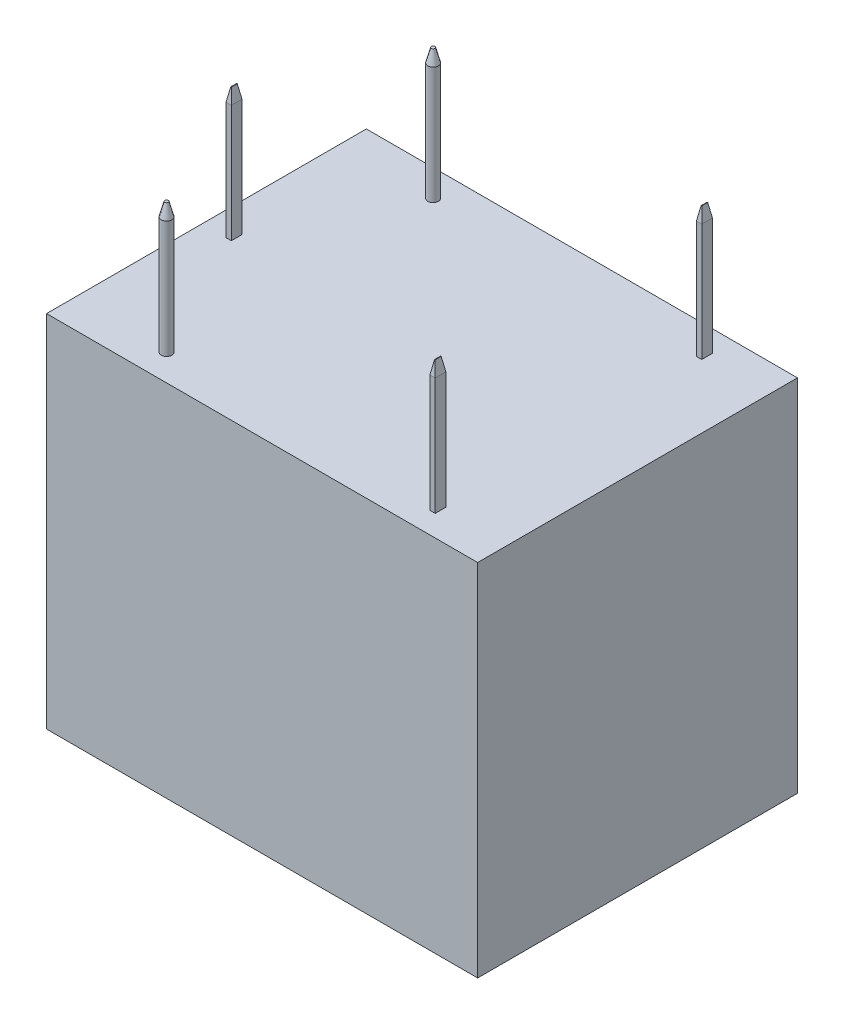
from build123d import *

# Parameters (mm, degrees)
SKETCH1_R             = 0.2
BOSS_EXTRUDE1_DEPTH   = 17.9
BOSS_EXTRUDE1_2_DEPTH = 17.9
SKETCH1_W             = 0.2
SKETCH1_H             = 0.4
BOSS_EXTRUDE1_3_DEPTH = 17.9
BOSS_EXTRUDE1_4_DEPTH = 17.9
BOSS_EXTRUDE1_5_DEPTH = 17.9
SKETCH2_W             = 16.174359041
SKETCH2_H             = 11.998212822
BOSS_EXTRUDE2_DEPTH   = 13.5
SKETCH3_W             = 0.2
SKETCH3_H             = 0.4
BOSS_EXTRUDE3_DEPTH   = 0.5
BOSS_EXTRUDE3_TAPER   = 10
SKETCH4_W             = 0.2
SKETCH4_H             = 0.4
BOSS_EXTRUDE4_DEPTH   = 0.5
BOSS_EXTRUDE4_TAPER   = 10
SKETCH5_W             = 0.2
SKETCH5_H             = 0.4
BOSS_EXTRUDE5_DEPTH   = 0.5
BOSS_EXTRUDE5_TAPER   = 10
SKETCH6_R             = 0.2
BOSS_EXTRUDE6_DEPTH   = 0.5
BOSS_EXTRUDE6_TAPER   = 15
SKETCH7_R             = 0.2
BOSS_EXTRUDE7_DEPTH   = 0.5
BOSS_EXTRUDE7_TAPER   = 15
SKETCH8_W             = 0.755826699
SKETCH8_H             = 2.00205672
CUT_EXTRUDE1_DEPTH    = 0.5
BOSS_EXTRUDE8_DEPTH   = 0.01
SKETCH10_W            = 0.480308949
SKETCH10_H            = 0.180115856
BOSS_EXTRUDE9_DEPTH   = 0.01
BOSS_EXTRUDE10_DEPTH  = 0.01


with BuildPart() as part:
    # Sketch1 → Boss-Extrude1 (new body)
    with BuildSketch(Plane(origin=(0, 0, 0), x_dir=(1, 0, 0), z_dir=(0, 1, 0))):
        with Locations((2.504868258, -5.033982321)):
            Circle(SKETCH1_R)
    extrude(amount=BOSS_EXTRUDE1_DEPTH)



with BuildPart() as body_2:
    # Sketch1 → Boss-Extrude1 2 (new body)
    with BuildSketch(Plane(origin=(0, 0, 0), x_dir=(1, 0, 0), z_dir=(0, 1, 0))):
        with Locations((2.504868258, 4.966017679)):
            Circle(SKETCH1_R)
    extrude(amount=BOSS_EXTRUDE1_2_DEPTH)


with BuildPart() as body_3:
    # Sketch1 → Boss-Extrude1 3 (new body)
    with BuildSketch(Plane(origin=(0, 0, 0), x_dir=(1, 0, 0), z_dir=(0, 1, 0))):
        with Locations((12.682585641, 4.966017679)):
            Rectangle(SKETCH1_W, SKETCH1_H)
    extrude(amount=BOSS_EXTRUDE1_3_DEPTH)


with BuildPart() as body_4:
    # Sketch1 → Boss-Extrude1 4 (new body)
    with BuildSketch(Plane(origin=(0, 0, 0), x_dir=(1, 0, 0), z_dir=(0, 1, 0))):
        Rectangle(SKETCH1_W, SKETCH1_H)
    extrude(amount=BOSS_EXTRUDE1_4_DEPTH)


with BuildPart() as body_5:
    # Sketch1 → Boss-Extrude1 5 (new body)
    with BuildSketch(Plane(origin=(0, 0, 0), x_dir=(1, 0, 0), z_dir=(0, 1, 0))):
        with Locations((12.682585641, -5.033982321)):
            Rectangle(SKETCH1_W, SKETCH1_H)
    extrude(amount=BOSS_EXTRUDE1_5_DEPTH)


with BuildPart() as part_1:
    add(part.part)

    add(body_2.part)  # Boss-Extrude2 merges body 2

    add(body_3.part)  # Boss-Extrude2 merges body 3

    add(body_4.part)  # Boss-Extrude2 merges body 4

    add(body_5.part)  # Boss-Extrude2 merges body 5
    # Sketch2 → Boss-Extrude2 (add)
    with BuildSketch(Plane(origin=(0, 0, 0), x_dir=(1, 0, 0), z_dir=(0, 1, 0))):
        with Locations((7.087179521, -0.034106118)):
            Rectangle(SKETCH2_W, SKETCH2_H)
    extrude(amount=BOSS_EXTRUDE2_DEPTH)

    # Sketch4 → Boss-Extrude4 (add)
    with BuildSketch(Plane(origin=(0, 17.9, 0), x_dir=(1, 0, 0), z_dir=(0, 1, 0))):
        with Locations((12.682585641, 4.966017679)):
            Rectangle(SKETCH4_W, SKETCH4_H)
    extrude(amount=BOSS_EXTRUDE4_DEPTH, taper=BOSS_EXTRUDE4_TAPER)

    # Sketch5 → Boss-Extrude5 (add)
    with BuildSketch(Plane(origin=(0, 17.9, 0), x_dir=(1, 0, 0), z_dir=(0, 1, 0))):
        Rectangle(SKETCH5_W, SKETCH5_H)
    extrude(amount=BOSS_EXTRUDE5_DEPTH, taper=BOSS_EXTRUDE5_TAPER)

    # Sketch6 → Boss-Extrude6 (add)
    with BuildSketch(Plane(origin=(0, 17.9, 0), x_dir=(1, 0, 0), z_dir=(0, 1, 0))):
        with Locations((2.504868258, 4.966017679)):
            Circle(SKETCH6_R)
    extrude(amount=BOSS_EXTRUDE6_DEPTH, taper=BOSS_EXTRUDE6_TAPER)

    # Sketch7 → Boss-Extrude7 (add)
    with BuildSketch(Plane(origin=(0, 17.9, 0), x_dir=(1, 0, 0), z_dir=(0, 1, 0))):
        with Locations((2.504868258, -5.033982321)):
            Circle(SKETCH7_R)
    extrude(amount=BOSS_EXTRUDE7_DEPTH, taper=BOSS_EXTRUDE7_TAPER)

    # Sketch8 → Cut-Extrude1 (cut)
    with BuildSketch(Plane.XZ):
        with Locations((-0.622086651, 0.037876461)):
            Rectangle(SKETCH8_W, SKETCH8_H)
    extrude(amount=-CUT_EXTRUDE1_DEPTH, mode=Mode.SUBTRACT)

    # Sketch9 → Boss-Extrude8 (add)
    # profile 1 of 8: a face of its own
    with BuildSketch(Plane.XZ):
        with BuildLine():
            Line((1.668383049, 2.912874336), (1.668383049, 3.783434306))
            Line((1.668383049, 3.783434306), (1.027971117, 4.967529284))
            Line((1.027971117, 4.967529284), (1.267291722, 4.967529284))
            Line((1.267291722, 4.967529284), (1.611262975, 4.34754716))
            add(Edge.make_bspline(
                [(1.611262975, 4.34754716), (1.627918318, 4.317451986), (1.660618496, 4.258364791), (1.706854224, 4.170139558), (1.750352717, 4.084508647), (1.777324676, 4.027678664), (1.790544961, 3.999823493)],
                knots=[0, 0, 0, 0, 1.054805564, 2.070946718, 3.054476075, 4, 4, 4, 4], degree=3))
            add(Edge.make_bspline(
                [(1.790544961, 3.999823493), (1.803079538, 4.027671105), (1.828958621, 4.085165721), (1.871355947, 4.173368862), (1.918049803, 4.266495767), (1.950864771, 4.330206061), (1.967742273, 4.362973749)],
                knots=[0, 0, 0, 0, 0.906747811, 1.872085736, 2.905564156, 4, 4, 4, 4], degree=3))
            Line((1.967742273, 4.362973749), (2.283361955, 4.967529284))
            Line((2.283361955, 4.967529284), (2.522265625, 4.967529284))
            Line((2.522265625, 4.967529284), (1.881853693, 3.783434306))
            Line((1.881853693, 3.783434306), (1.881853693, 2.912874336))
            Line((1.881853693, 2.912874336), (1.668383049, 2.912874336))
        make_face()
    # profile 2 of 8: a face of its own
    with BuildSketch(Plane.XZ):
        Polygon((2.762420099, 2.912874336), (2.762420099, 4.967529284), (2.975890743, 4.967529284), (2.975890743, 3.15302881), (3.829773319, 3.15302881), (3.829773319, 2.912874336), align=None)
    # profile 3 of 8: a face of its own
    with BuildSketch(Plane.XZ):
        Polygon((4.069927794, 2.912874336), (4.069927794, 4.967529284), (5.297383996, 4.967529284), (5.297383996, 4.727374809), (4.283398437, 4.727374809), (4.283398437, 4.086962877), (5.244016335, 4.086962877), (5.244016335, 3.846808403), (4.283398437, 3.846808403), (4.283398437, 3.15302881), (5.324067827, 3.15302881), (5.324067827, 2.912874336), align=None)
    # profile 4 of 8: a face of its own
    with BuildSketch(Plane.XZ):
        Polygon((6.12791822, 2.886190505), (6.641165022, 4.994213114), (6.805020419, 4.994213114), (6.291773617, 2.886190505), align=None)
    # profile 5 of 8: a face of its own
    with BuildSketch(Plane.XZ):
        Polygon((7.458774266, 2.912874336), (8.115029722, 4.967529284), (8.323080213, 4.967529284), (8.979752604, 2.912874336), (8.757943263, 2.912874336), (8.578244342, 3.526602437), (7.860282528, 3.526602437), (7.681000542, 2.912874336), align=None)
        with BuildLine():
            Line((7.930327583, 3.766756911), (8.507782352, 3.766756911))
            Line((8.507782352, 3.766756911), (8.336005194, 4.3312867))
            add(Edge.make_bspline(
                [(8.336005194, 4.3312867), (8.329578967, 4.352401539), (8.317032696, 4.393625183), (8.299266033, 4.453989286), (8.282214074, 4.51124351), (8.267648414, 4.565787232), (8.253164604, 4.616910787), (8.240673303, 4.665183094), (8.229460279, 4.710364584), (8.222572268, 4.739598463), (8.219263435, 4.753641705)],
                knots=[0, 0, 0, 0, 1.20859176, 2.359599242, 3.445754582, 4.479676267, 5.450859039, 6.355343929, 7.209947359, 8, 8, 8, 8], degree=3))
            add(Edge.make_bspline(
                [(8.219263435, 4.753641705), (8.213256476, 4.720931171), (8.201250537, 4.655553555), (8.178745877, 4.558161478), (8.153708761, 4.460945148), (8.133780139, 4.396808091), (8.123785354, 4.364641488)],
                knots=[0, 0, 0, 0, 0.995500629, 1.989678841, 2.991765375, 4, 4, 4, 4], degree=3))
            Line((8.123785354, 4.364641488), (7.930327583, 3.766756911))
        make_face(mode=Mode.SUBTRACT)
    # profile 6 of 8: a face of its own
    with BuildSketch(Plane.XZ):
        with BuildLine():
            Line((9.219907079, 2.912874336), (9.219907079, 4.967529284))
            Line((9.219907079, 4.967529284), (9.97455916, 4.967529284))
            add(Edge.make_bspline(
                [(9.97455916, 4.967529284), (9.993603652, 4.967419661), (10.030466229, 4.967207476), (10.08386701, 4.964155069), (10.133521389, 4.959636542), (10.179363213, 4.953628663), (10.22112487, 4.945299366), (10.258971974, 4.935195332), (10.293212427, 4.923917116), (10.333409425, 4.905313597), (10.379269105, 4.876457695), (10.428728738, 4.832494272), (10.472051343, 4.778051245), (10.510602037, 4.715498359), (10.542261059, 4.645266276), (10.564686559, 4.568673924), (10.578224392, 4.48672763), (10.579914923, 4.430292138), (10.580782434, 4.401331755)],
                knots=[0, 0, 0, 0, 0.957775898, 1.853873864, 2.6892683, 3.465319774, 4.178195347, 4.829309051, 5.435011313, 5.988660553, 7.053440284, 8.147710094, 9.30058322, 10.540256924, 11.835580405, 13.162637032, 14.543981594, 16, 16, 16, 16], degree=3))
            add(Edge.make_bspline(
                [(10.580782434, 4.401331755), (10.580328852, 4.382140452), (10.579442866, 4.344653837), (10.574075798, 4.289710705), (10.564749073, 4.237594256), (10.550485448, 4.188439348), (10.53394314, 4.141635147), (10.51222096, 4.098002103), (10.487298898, 4.056976697), (10.458332389, 4.018885013), (10.425932285, 3.983811991), (10.38956992, 3.952308938), (10.349952326, 3.92392852), (10.306770594, 3.898919934), (10.260291972, 3.876963064), (10.209966684, 3.859442413), (10.156579058, 3.844099121), (10.119443402, 3.837061499), (10.100473485, 3.833466488)],
                knots=[0, 0, 0, 0, 1.121977975, 2.191573688, 3.224240956, 4.211948119, 5.180998842, 6.122125515, 7.055751929, 7.983633331, 8.914994346, 9.842128418, 10.791356962, 11.759862547, 12.75578979, 13.791489111, 14.871831714, 16, 16, 16, 16], degree=3))
            add(Edge.make_bspline(
                [(10.100473485, 3.833466488), (10.114475213, 3.825719671), (10.141129069, 3.810972738), (10.177605844, 3.787179974), (10.208779435, 3.763231385), (10.226402154, 3.745803698), (10.234726507, 3.737571472)],
                knots=[0, 0, 0, 0, 1.158843086, 2.205987482, 3.152571606, 4, 4, 4, 4], degree=3))
            add(Edge.make_bspline(
                [(10.234726507, 3.737571472), (10.251376356, 3.717474436), (10.28486328, 3.677054374), (10.330768525, 3.612569232), (10.374739702, 3.545486648), (10.400561648, 3.498297508), (10.413591558, 3.474485581)],
                knots=[0, 0, 0, 0, 0.982253192, 1.975551771, 2.978451105, 4, 4, 4, 4], degree=3))
            Line((10.413591558, 3.474485581), (10.714201586, 2.912874336))
            Line((10.714201586, 2.912874336), (10.471545503, 2.912874336))
            Line((10.471545503, 2.912874336), (10.234309572, 3.352323669))
            add(Edge.make_bspline(
                [(10.234309572, 3.352323669), (10.223258047, 3.37292887), (10.202119117, 3.4123417), (10.170746752, 3.468302107), (10.141583943, 3.518770104), (10.114679938, 3.563794911), (10.089636031, 3.602898862), (10.067142956, 3.636619301), (10.04654348, 3.664572221), (10.021889167, 3.693372171), (9.993232535, 3.723226264), (9.959166767, 3.753209131), (9.925140564, 3.776452459), (9.890497227, 3.794153005), (9.852362353, 3.805813601), (9.809391855, 3.814541707), (9.759663636, 3.819289137), (9.724407466, 3.819834309), (9.705636181, 3.820124572)],
                knots=[0, 0, 0, 0, 1.483643366, 2.83785556, 4.070616892, 5.1822306, 6.165666296, 7.016844219, 7.754091418, 8.367230408, 9.421242841, 10.377779407, 11.241203819, 12.029974219, 12.835959019, 13.762973995, 14.808950166, 16, 16, 16, 16], degree=3))
            Line((9.705636181, 3.820124572), (9.433377723, 3.820124572))
            Line((9.433377723, 3.820124572), (9.433377723, 2.912874336))
            Line((9.433377723, 2.912874336), (9.219907079, 2.912874336))
        make_face()
        with BuildLine():
            Line((9.433377723, 4.060279047), (9.934116479, 4.060279047))
            add(Edge.make_bspline(
                [(9.934116479, 4.060279047), (9.959840837, 4.06078016), (10.008050795, 4.061719294), (10.075496512, 4.067956505), (10.133063364, 4.079243508), (10.181826643, 4.095682512), (10.223407729, 4.117464748), (10.259609513, 4.144438635), (10.291363243, 4.176653224), (10.318373181, 4.213915287), (10.340705763, 4.255411087), (10.355778453, 4.301026904), (10.36600919, 4.349455021), (10.36687052, 4.382930867), (10.36731179, 4.400080951)],
                knots=[0, 0, 0, 0, 1.47306528, 2.760668081, 3.873497699, 4.82484281, 5.696997418, 6.550136397, 7.399890849, 8.276969651, 9.17766846, 10.086208714, 11.019541422, 12, 12, 12, 12], degree=3))
            add(Edge.make_bspline(
                [(10.36731179, 4.400080951), (10.366926396, 4.412458106), (10.366175059, 4.436587695), (10.362221959, 4.471838718), (10.354506674, 4.505010891), (10.344326833, 4.536282471), (10.330640628, 4.565367757), (10.314658376, 4.592725864), (10.294530576, 4.617231996), (10.272626836, 4.640431985), (10.247278126, 4.661028278), (10.21897034, 4.678874503), (10.187709182, 4.693865656), (10.153794785, 4.706719949), (10.116538813, 4.715270179), (10.076814402, 4.722675591), (10.034127738, 4.726781236), (10.004725373, 4.727172907), (9.989568814, 4.727374809)],
                knots=[0, 0, 0, 0, 1.045235731, 2.037714497, 2.988326782, 3.915852726, 4.808207886, 5.697550021, 6.58254782, 7.478674216, 8.387536059, 9.331464042, 10.296946822, 11.310355404, 12.385965615, 13.518246496, 14.720686494, 16, 16, 16, 16], degree=3))
            Line((9.989568814, 4.727374809), (9.433377723, 4.727374809))
            Line((9.433377723, 4.727374809), (9.433377723, 4.060279047))
        make_face(mode=Mode.SUBTRACT)
    # profile 7 of 8: a face of its own
    with BuildSketch(Plane.XZ):
        with BuildLine():
            Line((10.92767223, 2.912874336), (10.92767223, 4.967529284))
            Line((10.92767223, 4.967529284), (11.560579335, 4.967529284))
            add(Edge.make_bspline(
                [(11.560579335, 4.967529284), (11.578650338, 4.967546241), (11.613416247, 4.967578864), (11.663719386, 4.965117813), (11.710486755, 4.962630984), (11.753554307, 4.957832496), (11.792954624, 4.952592722), (11.828647468, 4.946044992), (11.860639965, 4.937769772), (11.880540338, 4.931084276), (11.889957867, 4.927920473)],
                knots=[0, 0, 0, 0, 1.301145482, 2.503209419, 3.626350361, 4.67304202, 5.622796861, 6.488461115, 7.284688674, 8, 8, 8, 8], degree=3))
            add(Edge.make_bspline(
                [(11.889957867, 4.927920473), (11.901882862, 4.92330485), (11.925704592, 4.914084542), (11.959258864, 4.895881773), (11.991267343, 4.875374523), (12.02136727, 4.852028528), (12.049382109, 4.825483957), (12.075750379, 4.796324048), (12.09994821, 4.763949346), (12.12224317, 4.729049398), (12.143003225, 4.691976303), (12.160144042, 4.652276717), (12.175541592, 4.610787644), (12.18725678, 4.567023145), (12.197157228, 4.521292792), (12.203463031, 4.473457989), (12.207957429, 4.423515062), (12.208313809, 4.389529513), (12.208496094, 4.372146316)],
                knots=[0, 0, 0, 0, 0.897158766, 1.79219156, 2.674738776, 3.564969572, 4.462552928, 5.381685756, 6.322532571, 7.297145314, 8.28871417, 9.302465757, 10.330585605, 11.393732126, 12.480975679, 13.614163778, 14.779673607, 16, 16, 16, 16], degree=3))
            add(Edge.make_bspline(
                [(12.208496094, 4.372146316), (12.208143152, 4.349337466), (12.207452882, 4.304728706), (12.200675489, 4.239482948), (12.18941168, 4.1776207), (12.174043414, 4.118844775), (12.154084084, 4.063243933), (12.129368845, 4.010964285), (12.100374965, 3.9618186), (12.067274278, 3.915715179), (12.028268295, 3.873749944), (11.982233613, 3.837848993), (11.930149452, 3.80714425), (11.871365619, 3.782738784), (11.806481746, 3.763025765), (11.734909602, 3.749587129), (11.656925728, 3.741803669), (11.602847362, 3.740664729), (11.57475512, 3.740073081)],
                knots=[0, 0, 0, 0, 1.066125632, 2.085091685, 3.062630143, 4.003547869, 4.922307223, 5.820454748, 6.703048758, 7.586837887, 8.469431897, 9.371589709, 10.306565591, 11.287746888, 12.340181319, 13.471797101, 14.68666727, 16, 16, 16, 16], degree=3))
            Line((11.57475512, 3.740073081), (11.141142874, 3.740073081))
            Line((11.141142874, 3.740073081), (11.141142874, 2.912874336))
            Line((11.141142874, 2.912874336), (10.92767223, 2.912874336))
        make_face()
        with BuildLine():
            Line((11.141142874, 3.980227555), (11.588097035, 3.980227555))
            add(Edge.make_bspline(
                [(11.588097035, 3.980227555), (11.605058714, 3.98060863), (11.637922147, 3.981346966), (11.68562205, 3.985285097), (11.729806023, 3.992796), (11.770459756, 4.003081714), (11.807470078, 4.016494318), (11.841021617, 4.032622457), (11.87092281, 4.052034508), (11.89764469, 4.0742224), (11.920419855, 4.100002267), (11.940907131, 4.128084206), (11.957521812, 4.1597942), (11.9710995, 4.19437981), (11.982128337, 4.231728276), (11.989405242, 4.272129523), (11.994056569, 4.315473543), (11.994696072, 4.345449765), (11.99502545, 4.360889075)],
                knots=[0, 0, 0, 0, 1.269306236, 2.459294321, 3.577321076, 4.618943517, 5.592639886, 6.518111891, 7.397820391, 8.253919533, 9.107995395, 9.965041305, 10.848919063, 11.777714976, 12.741869721, 13.757527659, 14.845010431, 16, 16, 16, 16], degree=3))
            add(Edge.make_bspline(
                [(11.99502545, 4.360889075), (11.994551248, 4.380943597), (11.993633641, 4.419750249), (11.984142174, 4.475569744), (11.969459856, 4.527061927), (11.947971334, 4.573191029), (11.922840757, 4.61364174), (11.895322944, 4.648244398), (11.864588999, 4.675429862), (11.835985856, 4.692373864), (11.810866034, 4.703060091), (11.788480851, 4.709654647), (11.762632389, 4.7148345), (11.73341394, 4.719370446), (11.700882422, 4.72319514), (11.664975758, 4.725448551), (11.625640196, 4.727297722), (11.598245133, 4.72734835), (11.583927686, 4.727374809)],
                knots=[0, 0, 0, 0, 1.500314686, 2.903195123, 4.226916567, 5.498136997, 6.699407891, 7.786731959, 8.797026544, 9.75363827, 10.261964553, 10.838097333, 11.497334866, 12.234733717, 13.051831226, 13.948971176, 14.928073425, 16, 16, 16, 16], degree=3))
            Line((11.583927686, 4.727374809), (11.141142874, 4.727374809))
            Line((11.141142874, 4.727374809), (11.141142874, 3.980227555))
        make_face(mode=Mode.SUBTRACT)
    # profile 8 of 8: a face of its own
    with BuildSketch(Plane.XZ):
        Polygon((12.502018229, 2.912874336), (12.502018229, 4.967529284), (13.729474432, 4.967529284), (13.729474432, 4.727374809), (12.715488873, 4.727374809), (12.715488873, 4.086962877), (13.676106771, 4.086962877), (13.676106771, 3.846808403), (12.715488873, 3.846808403), (12.715488873, 3.15302881), (13.756158262, 3.15302881), (13.756158262, 2.912874336), align=None)
    extrude(amount=BOSS_EXTRUDE8_DEPTH)

    # Sketch10 → Boss-Extrude9 (add)
    # profile 1 of 10: a face of its own
    with BuildSketch(Plane.XZ):
        with BuildLine():
            Line((2.502252752, -2.681477614), (2.502252752, -2.028557636))
            Line((2.502252752, -2.028557636), (2.021943803, -1.140486403))
            Line((2.021943803, -1.140486403), (2.201434257, -1.140486403))
            Line((2.201434257, -1.140486403), (2.459412696, -1.605472996))
            add(Edge.make_bspline(
                [(2.459412696, -1.605472996), (2.471904204, -1.628044376), (2.496429337, -1.672359772), (2.531106133, -1.738528697), (2.563730003, -1.80275188), (2.583958973, -1.845374367), (2.593874186, -1.866265745)],
                knots=[0, 0, 0, 0, 1.054805564, 2.070946718, 3.054476075, 4, 4, 4, 4], degree=3))
            add(Edge.make_bspline(
                [(2.593874186, -1.866265745), (2.603275118, -1.845380036), (2.622684431, -1.802259074), (2.654482425, -1.736106719), (2.689502817, -1.66626154), (2.714114043, -1.618478819), (2.72677217, -1.593903054)],
                knots=[0, 0, 0, 0, 0.906747811, 1.872085736, 2.905564156, 4, 4, 4, 4], degree=3))
            Line((2.72677217, -1.593903054), (2.963486932, -1.140486403))
            Line((2.963486932, -1.140486403), (3.142664684, -1.140486403))
            Line((3.142664684, -1.140486403), (2.662355735, -2.028557636))
            Line((2.662355735, -2.028557636), (2.662355735, -2.681477614))
            Line((2.662355735, -2.681477614), (2.502252752, -2.681477614))
        make_face()
    # profile 2 of 10: a face of its own
    with BuildSketch(Plane.XZ):
        Polygon((3.18269043, -2.681477614), (3.674882022, -1.140486403), (3.83091989, -1.140486403), (4.323424183, -2.681477614), (4.157067178, -2.681477614), (4.022292987, -2.221181538), (3.483821626, -2.221181538), (3.349360137, -2.681477614), align=None)
        with BuildLine():
            Line((3.536355417, -2.041065682), (3.969446494, -2.041065682))
            Line((3.969446494, -2.041065682), (3.840613625, -1.61766834))
            add(Edge.make_bspline(
                [(3.840613625, -1.61766834), (3.835793955, -1.601832211), (3.826384252, -1.570914478), (3.813059255, -1.5256414), (3.800270285, -1.482700733), (3.789346041, -1.441792941), (3.778483183, -1.403450275), (3.769114708, -1.367246045), (3.76070494, -1.333359927), (3.755538931, -1.311434518), (3.753057306, -1.300902087)],
                knots=[0, 0, 0, 0, 1.20859176, 2.359599242, 3.445754582, 4.479676267, 5.450859039, 6.355343929, 7.209947359, 8, 8, 8, 8], degree=3))
            add(Edge.make_bspline(
                [(3.753057306, -1.300902087), (3.748552087, -1.325434987), (3.739547633, -1.374468199), (3.722669138, -1.447512257), (3.703891301, -1.520424504), (3.688944834, -1.568527297), (3.681448746, -1.592652249)],
                knots=[0, 0, 0, 0, 0.995500629, 1.989678841, 2.991765375, 4, 4, 4, 4], degree=3))
            Line((3.681448746, -1.592652249), (3.536355417, -2.041065682))
        make_face(mode=Mode.SUBTRACT)
    # profile 3 of 10: a face of its own
    with BuildSketch(Plane.XZ):
        with BuildLine():
            Line((4.44350142, -2.261207283), (4.603604403, -2.24119441))
            add(Edge.make_bspline(
                [(4.603604403, -2.24119441), (4.605669294, -2.25331002), (4.609693009, -2.276918907), (4.617609898, -2.310893103), (4.626250435, -2.342684119), (4.63626501, -2.371992677), (4.647181188, -2.399105054), (4.659286494, -2.423848375), (4.672820673, -2.446218499), (4.687450588, -2.466228391), (4.703221427, -2.483972809), (4.720061448, -2.49933552), (4.738128365, -2.512305536), (4.757249955, -2.523099355), (4.777728811, -2.531106664), (4.79916256, -2.537217834), (4.821866131, -2.540616765), (4.837390032, -2.541126858), (4.845322384, -2.541387503)],
                knots=[0, 0, 0, 0, 1.392235382, 2.712957193, 3.95076201, 5.123471921, 6.220028287, 7.260520794, 8.240826993, 9.178593426, 10.065213643, 10.926376853, 11.755607984, 12.580369742, 13.407158359, 14.241002189, 15.101193065, 16, 16, 16, 16], degree=3))
            add(Edge.make_bspline(
                [(4.845322384, -2.541387503), (4.853998345, -2.541222425), (4.871051094, -2.54089796), (4.896040735, -2.536064255), (4.920319551, -2.529465153), (4.943468896, -2.519186803), (4.965896404, -2.506557321), (4.987630163, -2.491320091), (5.007816084, -2.472483167), (5.027473313, -2.451776501), (5.045603435, -2.428788975), (5.061235883, -2.403681542), (5.074401471, -2.376822199), (5.085449215, -2.348532182), (5.093355152, -2.318351647), (5.099867781, -2.286882067), (5.103134624, -2.253458233), (5.103657968, -2.230672303), (5.103926225, -2.21899263)],
                knots=[0, 0, 0, 0, 0.904038564, 1.776903143, 2.648138989, 3.525264603, 4.411852617, 5.332561374, 6.2875971, 7.288147468, 8.311042921, 9.337403868, 10.368883854, 11.429611823, 12.501164111, 13.621320171, 14.780729868, 16, 16, 16, 16], degree=3))
            add(Edge.make_bspline(
                [(5.103926225, -2.21899263), (5.103642659, -2.208041575), (5.103090565, -2.18672022), (5.100053968, -2.155532926), (5.094490193, -2.125986019), (5.08617709, -2.098160207), (5.076332823, -2.071626871), (5.063767409, -2.046927736), (5.048939466, -2.023921436), (5.032164021, -2.002771259), (5.013643063, -1.983709949), (4.994110439, -1.966743784), (4.973249446, -1.952644367), (4.951585758, -1.940772401), (4.928528598, -1.932238714), (4.90474988, -1.925446123), (4.879734268, -1.921694523), (4.862740959, -1.921226855), (4.854078015, -1.920988444)],
                knots=[0, 0, 0, 0, 1.208507307, 2.352925112, 3.453685551, 4.520081629, 5.553915499, 6.572344605, 7.570902253, 8.569592363, 9.545641393, 10.499968035, 11.418701314, 12.319183888, 13.218416966, 14.125267075, 15.044288268, 16, 16, 16, 16], degree=3))
            add(Edge.make_bspline(
                [(4.854078015, -1.920988444), (4.846244483, -1.921234977), (4.829545548, -1.921760515), (4.803250697, -1.926305417), (4.774150501, -1.932693227), (4.754178861, -1.938961512), (4.743694513, -1.942252122)],
                knots=[0, 0, 0, 0, 0.832645691, 1.774971563, 2.831945141, 4, 4, 4, 4], degree=3))
            Line((4.743694513, -1.942252122), (4.763707386, -1.760885462))
            Line((4.763707386, -1.760885462), (4.787785374, -1.763074369))
            add(Edge.make_bspline(
                [(4.787785374, -1.763074369), (4.797076986, -1.762968993), (4.815208061, -1.762763367), (4.841725105, -1.758963495), (4.867020288, -1.753929184), (4.89083769, -1.746288665), (4.913466821, -1.736896393), (4.934555121, -1.724991403), (4.954487317, -1.711109831), (4.972907007, -1.695251006), (4.989442536, -1.677321935), (5.004213828, -1.658074767), (5.016423561, -1.63720868), (5.026569337, -1.615131741), (5.034348805, -1.591524878), (5.040026185, -1.566512114), (5.043043853, -1.539983022), (5.043601542, -1.521884372), (5.043887607, -1.512600757)],
                knots=[0, 0, 0, 0, 1.104467345, 2.155189185, 3.181695374, 4.170183668, 5.126157628, 6.092295424, 7.04536858, 8.012620263, 8.977961638, 9.942904556, 10.893715412, 11.848320646, 12.828840281, 13.845861792, 14.895045293, 16, 16, 16, 16], degree=3))
            add(Edge.make_bspline(
                [(5.043887607, -1.512600757), (5.043170027, -1.495971297), (5.041790967, -1.464012447), (5.031205107, -1.41849373), (5.012758766, -1.378202571), (4.987365036, -1.343754597), (4.956806943, -1.315995014), (4.922669934, -1.295192193), (4.884810947, -1.282866476), (4.858439988, -1.281349225), (4.845009682, -1.280576513)],
                knots=[0, 0, 0, 0, 1.168747258, 2.246123166, 3.262822778, 4.26410748, 5.234436762, 6.148309006, 7.056963545, 8, 8, 8, 8], degree=3))
            add(Edge.make_bspline(
                [(4.845009682, -1.280576513), (4.831054381, -1.281225373), (4.803906483, -1.282487633), (4.765086745, -1.29452905), (4.729372124, -1.312975124), (4.703337623, -1.335161101), (4.684888411, -1.356166488), (4.671871108, -1.373866956), (4.660304098, -1.393549679), (4.650500974, -1.415390406), (4.641066005, -1.438786194), (4.634393475, -1.464535192), (4.627728721, -1.491852656), (4.62501677, -1.510901096), (4.623617276, -1.520730987)],
                knots=[0, 0, 0, 0, 1.389180941, 2.702438466, 4.019316734, 5.377896697, 6.085434137, 6.807430375, 7.567469407, 8.358691296, 9.195188439, 10.081130764, 11.009773198, 12, 12, 12, 12], degree=3))
            Line((4.623617276, -1.520730987), (4.463514293, -1.500718114))
            add(Edge.make_bspline(
                [(4.463514293, -1.500718114), (4.466135874, -1.485461036), (4.471249796, -1.455699033), (4.481933974, -1.412873151), (4.494649562, -1.372864932), (4.510045089, -1.335894683), (4.527526016, -1.30164145), (4.547304061, -1.270249788), (4.569121614, -1.241513601), (4.593736646, -1.216226585), (4.619898279, -1.193704713), (4.647621709, -1.174254409), (4.676412647, -1.157512891), (4.706745634, -1.144025636), (4.738335849, -1.133330872), (4.771341463, -1.125846757), (4.805592888, -1.121422403), (4.828840484, -1.120792846), (4.840631866, -1.12047353)],
                knots=[0, 0, 0, 0, 1.259750421, 2.457396855, 3.589696629, 4.673763457, 5.713494597, 6.716289503, 7.690389722, 8.644478697, 9.583164327, 10.496506905, 11.397350125, 12.289843847, 13.194037124, 14.107891875, 15.040306322, 16, 16, 16, 16], degree=3))
            add(Edge.make_bspline(
                [(4.840631866, -1.12047353), (4.853056149, -1.120840017), (4.877499029, -1.121561026), (4.913424942, -1.127093264), (4.947975874, -1.135716185), (4.981059841, -1.148287875), (5.012382773, -1.164847825), (5.042716222, -1.1842665), (5.071548728, -1.207532383), (5.098428409, -1.234265361), (5.123101554, -1.263518774), (5.14474254, -1.294949963), (5.163330205, -1.3280283), (5.178090096, -1.363232961), (5.189626981, -1.400208538), (5.198057434, -1.439015164), (5.203219723, -1.47973157), (5.203729734, -1.507477767), (5.203990589, -1.521669091)],
                knots=[0, 0, 0, 0, 0.987546189, 1.94284647, 2.883618689, 3.814886987, 4.749064414, 5.696240478, 6.674807358, 7.688712876, 8.706405422, 9.713376545, 10.718845743, 11.717906576, 12.742863162, 13.794678478, 14.872046121, 16, 16, 16, 16], degree=3))
            add(Edge.make_bspline(
                [(5.203990589, -1.521669091), (5.203508898, -1.538804532), (5.202568161, -1.572269798), (5.193500442, -1.620813988), (5.17911, -1.666356734), (5.159038882, -1.70859511), (5.134027932, -1.747312113), (5.103986657, -1.781559546), (5.069701594, -1.811916215), (5.043632741, -1.827863923), (5.030441458, -1.835933735)],
                knots=[0, 0, 0, 0, 1.090109576, 2.128968013, 3.132278696, 4.123864162, 5.09769889, 6.057339906, 7.016980922, 8, 8, 8, 8], degree=3))
            add(Edge.make_bspline(
                [(5.030441458, -1.835933735), (5.042558513, -1.839662026), (5.0662337, -1.846946632), (5.098895408, -1.8633512), (5.128677315, -1.882401997), (5.155287992, -1.905252628), (5.178955568, -1.931910825), (5.200089179, -1.962561695), (5.218246784, -1.997498178), (5.234651257, -2.035849515), (5.247506945, -2.077588392), (5.257383876, -2.121880318), (5.262984716, -2.168711937), (5.263675772, -2.200737257), (5.264029208, -2.217116423)],
                knots=[0, 0, 0, 0, 0.945190562, 1.846782401, 2.71900073, 3.580139159, 4.456653473, 5.37426406, 6.352713278, 7.392141409, 8.485180558, 9.608884637, 10.777077804, 12, 12, 12, 12], degree=3))
            add(Edge.make_bspline(
                [(5.264029208, -2.217116423), (5.263722545, -2.234543216), (5.263123843, -2.268565711), (5.256862817, -2.318432359), (5.247387159, -2.365862018), (5.233870293, -2.411024227), (5.216403442, -2.453569586), (5.194833082, -2.493741404), (5.16961408, -2.531543839), (5.140578482, -2.566446699), (5.108829767, -2.597696971), (5.07556075, -2.625623263), (5.040520241, -2.649051182), (5.004006683, -2.668405764), (4.965856765, -2.683102806), (4.926274636, -2.693844066), (4.885031291, -2.700188187), (4.857018211, -2.70105246), (4.842820774, -2.701490486)],
                knots=[0, 0, 0, 0, 1.16797173, 2.280242353, 3.364490462, 4.408173669, 5.436152277, 6.443028727, 7.460738993, 8.478233232, 9.481512989, 10.444418881, 11.386528098, 12.302557467, 13.209825675, 14.12198051, 15.04819242, 16, 16, 16, 16], degree=3))
            add(Edge.make_bspline(
                [(4.842820774, -2.701490486), (4.829666252, -2.701143128), (4.803754655, -2.700458905), (4.765711863, -2.694647614), (4.72920779, -2.685320917), (4.694379723, -2.67201883), (4.660820851, -2.655384369), (4.629051289, -2.634671988), (4.598675586, -2.610273374), (4.57013318, -2.582355248), (4.544051006, -2.551103561), (4.520360929, -2.517411279), (4.499552678, -2.481100627), (4.482614753, -2.441816161), (4.468119804, -2.400343685), (4.456527323, -2.356352651), (4.448026065, -2.309719289), (4.445030587, -2.277602593), (4.44350142, -2.261207283)],
                knots=[0, 0, 0, 0, 0.959274814, 1.889566238, 2.800731978, 3.703256649, 4.604498869, 5.528396462, 6.464265966, 7.442996794, 8.436156864, 9.429840861, 10.444772988, 11.483305447, 12.546329121, 13.647537524, 14.799087218, 16, 16, 16, 16], degree=3))
        make_face()
    # profile 4 of 10: a face of its own
    with BuildSketch(Plane.XZ):
        with BuildLine():
            Line((6.004505504, -2.681477614), (5.844402521, -2.681477614))
            Line((5.844402521, -2.681477614), (5.844402521, -1.460692368))
            add(Edge.make_bspline(
                [(5.844402521, -1.460692368), (5.834570013, -1.472010429), (5.814192148, -1.495467099), (5.778817221, -1.528825751), (5.739395773, -1.563225328), (5.695750996, -1.596605069), (5.651280443, -1.628577461), (5.607357507, -1.656697735), (5.5656284, -1.681164493), (5.537634059, -1.694463307), (5.524196555, -1.700846843)],
                knots=[0, 0, 0, 0, 0.892555828, 1.849821039, 2.893015883, 4.008277588, 5.121255548, 6.154629642, 7.114207698, 8, 8, 8, 8], degree=3))
            Line((5.524196555, -1.700846843), (5.524196555, -1.520730987))
            add(Edge.make_bspline(
                [(5.524196555, -1.520730987), (5.545791708, -1.507734202), (5.5887971, -1.481851921), (5.649053282, -1.437015451), (5.705976519, -1.388621853), (5.757865389, -1.336164071), (5.804326173, -1.28208795), (5.844204532, -1.228119916), (5.87690226, -1.174833369), (5.892941543, -1.138178372), (5.900688726, -1.12047353)],
                knots=[0, 0, 0, 0, 1.082272232, 2.155277244, 3.222407096, 4.289527553, 5.32168536, 6.282742408, 7.170542132, 8, 8, 8, 8], degree=3))
            Line((5.900688726, -1.12047353), (6.004505504, -1.12047353))
            Line((6.004505504, -1.12047353), (6.004505504, -2.681477614))
        make_face()
    # profile 5 of 10: a face of its own
    with BuildSketch(Plane.XZ):
        with BuildLine():
            add(Edge.make_bspline(
                [(6.652109562, -1.835933735), (6.637378578, -1.828530967), (6.608638174, -1.814088041), (6.570330484, -1.785798539), (6.537665261, -1.752945225), (6.51075767, -1.715291454), (6.489939252, -1.672800517), (6.475464886, -1.625621599), (6.46605329, -1.573846173), (6.465229648, -1.537661097), (6.46480158, -1.51885478)],
                knots=[0, 0, 0, 0, 1.008302473, 1.967215395, 2.901654035, 3.835241807, 4.788827276, 5.786238528, 6.849451133, 8, 8, 8, 8], degree=3))
            add(Edge.make_bspline(
                [(6.46480158, -1.51885478), (6.465088251, -1.50445779), (6.465648651, -1.47631381), (6.470431552, -1.435094537), (6.478286993, -1.396019487), (6.488686996, -1.358801446), (6.503074725, -1.324006644), (6.519850925, -1.29081244), (6.540326558, -1.259957327), (6.563344101, -1.231160714), (6.588889093, -1.205361259), (6.616192309, -1.182683268), (6.645165954, -1.163368594), (6.675872113, -1.147797526), (6.708028384, -1.135471649), (6.741762714, -1.126590318), (6.777150764, -1.121698673), (6.801254013, -1.120885458), (6.81346335, -1.12047353)],
                knots=[0, 0, 0, 0, 1.165528948, 2.278436123, 3.35437051, 4.390847764, 5.401785756, 6.398351761, 7.397951243, 8.394481506, 9.379254266, 10.332413116, 11.264104055, 12.192693114, 13.114390379, 14.047914605, 15.011184464, 16, 16, 16, 16], degree=3))
            add(Edge.make_bspline(
                [(6.81346335, -1.12047353), (6.825781695, -1.120850205), (6.850116886, -1.121594336), (6.885759449, -1.12699826), (6.919822, -1.135783898), (6.952304894, -1.14799459), (6.983156268, -1.164075539), (7.01217752, -1.183873932), (7.039728146, -1.20702324), (7.065440669, -1.233372561), (7.088778412, -1.262619371), (7.109121175, -1.294129959), (7.126914529, -1.327334001), (7.140901755, -1.362965556), (7.151886101, -1.40064766), (7.15958578, -1.440426023), (7.164401441, -1.48215022), (7.164964956, -1.51060693), (7.165252131, -1.525108803)],
                knots=[0, 0, 0, 0, 0.985268531, 1.946421878, 2.87680472, 3.795226773, 4.71648376, 5.65319809, 6.600248485, 7.590936614, 8.593729089, 9.588305238, 10.588007114, 11.602279753, 12.644649782, 13.724021809, 14.840134863, 16, 16, 16, 16], degree=3))
            add(Edge.make_bspline(
                [(7.165252131, -1.525108803), (7.16479516, -1.54318364), (7.163914909, -1.578000702), (7.154836089, -1.628002573), (7.140702481, -1.673844194), (7.120124249, -1.715267073), (7.093819587, -1.752486707), (7.061515482, -1.785138721), (7.023536289, -1.813951749), (6.994681488, -1.828461008), (6.979820356, -1.835933735)],
                knots=[0, 0, 0, 0, 1.126288406, 2.16953834, 3.158564267, 4.109347243, 5.041996175, 5.989081932, 6.964313779, 8, 8, 8, 8], degree=3))
            add(Edge.make_bspline(
                [(6.979820356, -1.835933735), (6.989481142, -1.839841822), (7.008611675, -1.847580715), (7.035703141, -1.861778371), (7.06126099, -1.877335325), (7.084721372, -1.89504584), (7.106785824, -1.914152451), (7.127164406, -1.935111972), (7.145609348, -1.957989225), (7.162150276, -1.982567618), (7.177415572, -2.008485851), (7.189970057, -2.036397352), (7.201133211, -2.065554364), (7.209753377, -2.096368311), (7.216662429, -2.128639419), (7.221551683, -2.162382672), (7.224880522, -2.197662408), (7.225151813, -2.221694615), (7.225290749, -2.234002284)],
                knots=[0, 0, 0, 0, 0.998518868, 1.977292132, 2.928488769, 3.863806314, 4.791620617, 5.724425947, 6.662355446, 7.604692757, 8.562792825, 9.541974082, 10.534927333, 11.553397264, 12.605860047, 13.696849039, 14.820482036, 16, 16, 16, 16], degree=3))
            add(Edge.make_bspline(
                [(7.225290749, -2.234002284), (7.22490412, -2.250795045), (7.224145683, -2.283736808), (7.218973094, -2.332025028), (7.209381546, -2.377876711), (7.196764932, -2.42152502), (7.180027842, -2.462604485), (7.159992617, -2.501517944), (7.135775657, -2.537740281), (7.108326365, -2.571438423), (7.078320191, -2.601875367), (7.046084272, -2.628401289), (7.012225578, -2.65107149), (6.976432533, -2.669753179), (6.938610325, -2.683644274), (6.899316374, -2.694241434), (6.858145938, -2.700091503), (6.830157621, -2.701019769), (6.815964959, -2.701490486)],
                knots=[0, 0, 0, 0, 1.159749967, 2.275040396, 3.347967098, 4.391166783, 5.408413163, 6.406504519, 7.408740576, 8.411571025, 9.404143995, 10.355316395, 11.289670068, 12.213679047, 13.136228826, 14.066859406, 15.019719104, 16, 16, 16, 16], degree=3))
            add(Edge.make_bspline(
                [(6.815964959, -2.701490486), (6.801563264, -2.70102499), (6.773261932, -2.700110226), (6.731684184, -2.694228655), (6.692149748, -2.683715492), (6.654189859, -2.669661652), (6.618182034, -2.651184151), (6.584270263, -2.628285561), (6.551731957, -2.601999555), (6.521780135, -2.571396685), (6.494106386, -2.537816453), (6.470509787, -2.500993673), (6.449842471, -2.462010108), (6.433368786, -2.420233746), (6.420490938, -2.375948991), (6.411592723, -2.329033091), (6.405771172, -2.279698518), (6.405103213, -2.245901977), (6.404762962, -2.228686365)],
                knots=[0, 0, 0, 0, 0.984972937, 1.935608695, 2.864070717, 3.777636659, 4.698984135, 5.624239024, 6.571662262, 7.554569506, 8.54763434, 9.542156389, 10.540146702, 11.560717074, 12.60743999, 13.689489912, 14.823049757, 16, 16, 16, 16], degree=3))
            add(Edge.make_bspline(
                [(6.404762962, -2.228686365), (6.404914173, -2.216067624), (6.405210842, -2.191310439), (6.408394452, -2.154955914), (6.413701051, -2.120294195), (6.420864553, -2.08738056), (6.429901343, -2.056183201), (6.441182456, -2.026680622), (6.454609071, -1.998873681), (6.470047952, -1.972767497), (6.487127237, -1.948448871), (6.505935614, -1.926129317), (6.526422776, -1.9060112), (6.548401355, -1.887831117), (6.57190626, -1.871372571), (6.597259181, -1.857462391), (6.624027541, -1.845395497), (6.642669424, -1.839114429), (6.652109562, -1.835933735)],
                knots=[0, 0, 0, 0, 1.21084686, 2.375606163, 3.49898943, 4.574306622, 5.606312177, 6.613285576, 7.602106595, 8.566331322, 9.521116698, 10.451051306, 11.363604456, 12.273026677, 13.186018397, 14.112988761, 15.044428814, 16, 16, 16, 16], degree=3))
        make_face()
        with BuildLine():
            add(Edge.make_bspline(
                [(6.624904563, -1.514476964), (6.625505739, -1.532352624), (6.626656044, -1.566556342), (6.636979809, -1.615186018), (6.654563545, -1.658024302), (6.678632753, -1.69466546), (6.708077967, -1.723744998), (6.740919205, -1.745577715), (6.777494323, -1.758701354), (6.803041413, -1.760151748), (6.815964959, -1.760885462)],
                knots=[0, 0, 0, 0, 1.231806288, 2.356967922, 3.407623546, 4.408504678, 5.359070988, 6.242373184, 7.110866593, 8, 8, 8, 8], degree=3))
            add(Edge.make_bspline(
                [(6.815964959, -1.760885462), (6.828692069, -1.760167853), (6.853856831, -1.758748957), (6.889646909, -1.745382763), (6.922426435, -1.724479635), (6.951203676, -1.695556496), (6.975287552, -1.660194836), (6.992934635, -1.619276028), (7.003364177, -1.573468054), (7.004539302, -1.541425159), (7.005149148, -1.524796102)],
                knots=[0, 0, 0, 0, 0.904069307, 1.787576968, 2.686104763, 3.657927982, 4.673759711, 5.718490521, 6.815982417, 8, 8, 8, 8], degree=3))
            add(Edge.make_bspline(
                [(7.005149148, -1.524796102), (7.004563012, -1.507642942), (7.003431885, -1.474540759), (6.992688447, -1.427389091), (6.974679498, -1.385097072), (6.949606446, -1.348843324), (6.920393311, -1.31870224), (6.887479981, -1.296800385), (6.851711221, -1.283037929), (6.826716112, -1.281402646), (6.814088752, -1.280576513)],
                knots=[0, 0, 0, 0, 1.195037322, 2.306184118, 3.351541185, 4.382027117, 5.363972266, 6.261309376, 7.121625266, 8, 8, 8, 8], degree=3))
            add(Edge.make_bspline(
                [(6.814088752, -1.280576513), (6.801469521, -1.28130179), (6.776514889, -1.282736033), (6.740772773, -1.296069066), (6.708196167, -1.317765688), (6.67937946, -1.347094004), (6.65476546, -1.382190305), (6.637727964, -1.422743991), (6.626555151, -1.467182253), (6.625467301, -1.498352696), (6.624904563, -1.514476964)],
                knots=[0, 0, 0, 0, 0.904281018, 1.788222997, 2.702503877, 3.698439792, 4.727116192, 5.763971808, 6.843317031, 8, 8, 8, 8], degree=3))
        make_face(mode=Mode.SUBTRACT)
        with BuildLine():
            add(Edge.make_bspline(
                [(6.564865945, -2.228060963), (6.565116921, -2.239536176), (6.565608617, -2.262017671), (6.569132365, -2.294828732), (6.57457201, -2.325954491), (6.582866635, -2.35519427), (6.593102238, -2.382912847), (6.605945543, -2.408872688), (6.621119423, -2.433094807), (6.638071645, -2.455604427), (6.657226671, -2.475322732), (6.676979045, -2.493166143), (6.697795923, -2.50815672), (6.719776229, -2.520249902), (6.742585887, -2.529544417), (6.766217791, -2.536573745), (6.790799326, -2.540754587), (6.807506087, -2.541174762), (6.815964959, -2.541387503)],
                knots=[0, 0, 0, 0, 1.229957658, 2.409653497, 3.534020377, 4.613053928, 5.663236106, 6.697665706, 7.711552779, 8.723960985, 9.711901018, 10.6537745, 11.574735704, 12.45493582, 13.336836533, 14.210201145, 15.093799183, 16, 16, 16, 16], degree=3))
            add(Edge.make_bspline(
                [(6.815964959, -2.541387503), (6.824531598, -2.541191233), (6.841349583, -2.540805917), (6.866059789, -2.536432502), (6.889796833, -2.53001832), (6.912521187, -2.520789079), (6.934305062, -2.509178538), (6.954932663, -2.494735172), (6.974488614, -2.477517429), (6.993151762, -2.458134315), (7.009804933, -2.436129669), (7.025196869, -2.412818844), (7.03706429, -2.38711258), (7.04773687, -2.360205558), (7.055226055, -2.331164033), (7.061490822, -2.300532975), (7.064293521, -2.267929082), (7.06488544, -2.245679222), (7.065187766, -2.234314985)],
                knots=[0, 0, 0, 0, 0.929108295, 1.824020855, 2.716353585, 3.594799272, 4.480866403, 5.391315445, 6.321801218, 7.306391719, 8.306918377, 9.31465165, 10.332061206, 11.374528197, 12.453461109, 13.583192095, 14.765602254, 16, 16, 16, 16], degree=3))
            add(Edge.make_bspline(
                [(7.065187766, -2.234314985), (7.064926297, -2.22284174), (7.064414043, -2.200364101), (7.061035389, -2.167506384), (7.055067831, -2.136460054), (7.046904485, -2.107175155), (7.036620338, -2.079469762), (7.023814301, -2.053433491), (7.008416849, -2.029275484), (6.99081303, -2.007159273), (6.972003125, -1.986944655), (6.951927331, -1.969276575), (6.930780361, -1.954518002), (6.908873299, -1.942130863), (6.885896462, -1.93284774), (6.862177797, -1.9257558), (6.837374028, -1.92162926), (6.820461985, -1.921203829), (6.811899844, -1.920988444)],
                knots=[0, 0, 0, 0, 1.22586307, 2.401631645, 3.524301147, 4.599742544, 5.646428614, 6.677414549, 7.693861764, 8.700930997, 9.693673486, 10.640764112, 11.552218418, 12.444626848, 13.323591672, 14.194048812, 15.08569251, 16, 16, 16, 16], degree=3))
            add(Edge.make_bspline(
                [(6.811899844, -1.920988444), (6.803442895, -1.921206411), (6.786739933, -1.921636907), (6.76222959, -1.925725598), (6.738922256, -1.932948868), (6.716146029, -1.941652681), (6.694867462, -1.954354634), (6.674055017, -1.96884909), (6.654727732, -1.98667163), (6.636296386, -2.006546038), (6.619540041, -2.028641087), (6.60472071, -2.052433246), (6.592521239, -2.077975245), (6.582593362, -2.105036865), (6.574308916, -2.133501298), (6.568737432, -2.163666319), (6.565713997, -2.195373582), (6.565152758, -2.217006007), (6.564865945, -2.228060963)],
                knots=[0, 0, 0, 0, 0.923472587, 1.823911596, 2.703001348, 3.586871794, 4.479500873, 5.402130619, 6.35347509, 7.344669241, 8.360414412, 9.377945173, 10.401637647, 11.446516964, 12.524200813, 13.636404357, 14.792116778, 16, 16, 16, 16], degree=3))
        make_face(mode=Mode.SUBTRACT)
    # profile 6 of 10: a face of its own
    with BuildSketch(Plane.XZ):
        with Locations((7.605535334, -2.13112361)):
            Rectangle(SKETCH10_W, SKETCH10_H)
    # profile 7 of 10: a face of its own
    with BuildSketch(Plane.XZ):
        with BuildLine():
            Line((8.786294833, -2.501361758), (8.786294833, -2.681477614))
            Line((8.786294833, -2.681477614), (7.965767045, -2.681477614))
            add(Edge.make_bspline(
                [(7.965767045, -2.681477614), (7.965729054, -2.672092824), (7.965652084, -2.653079087), (7.968211104, -2.624090966), (7.973468831, -2.594401026), (7.980182412, -2.563613199), (7.989701537, -2.53213241), (8.001354712, -2.499805695), (8.015104434, -2.466713537), (8.031204104, -2.43265995), (8.050017378, -2.397318289), (8.072719548, -2.360836416), (8.098809971, -2.322559929), (8.12832315, -2.282722173), (8.161836294, -2.241700961), (8.198354698, -2.198887339), (8.238399529, -2.15437048), (8.266911534, -2.124784163), (8.281595195, -2.109547231)],
                knots=[0, 0, 0, 0, 0.672188691, 1.361865275, 2.08134618, 2.831455259, 3.618325166, 4.435686407, 5.292818481, 6.184803937, 7.133719261, 8.159707436, 9.261705982, 10.452168352, 11.710682541, 13.056179633, 14.483934645, 16, 16, 16, 16], degree=3))
            add(Edge.make_bspline(
                [(8.281595195, -2.109547231), (8.298659256, -2.09189738), (8.331514778, -2.057913965), (8.377755788, -2.007735371), (8.419770389, -1.961094991), (8.456719158, -1.917149429), (8.489258069, -1.876497212), (8.517714501, -1.839196464), (8.540728519, -1.804400667), (8.565577116, -1.763458414), (8.589266723, -1.71471731), (8.610209677, -1.657901841), (8.623741507, -1.60297819), (8.62539097, -1.566768197), (8.62619185, -1.549186791)],
                knots=[0, 0, 0, 0, 1.312560889, 2.527233899, 3.64818266, 4.668586789, 5.596397896, 6.432357998, 7.175835261, 7.825761013, 8.992224112, 10.065918602, 11.060925749, 12, 12, 12, 12], degree=3))
            add(Edge.make_bspline(
                [(8.62619185, -1.549186791), (8.626080178, -1.539480455), (8.625862071, -1.520522965), (8.622155651, -1.492837579), (8.616869806, -1.466504489), (8.609890925, -1.44133338), (8.599995677, -1.417737694), (8.5881395, -1.395553723), (8.574251672, -1.374680993), (8.558403551, -1.355426027), (8.540926678, -1.338055642), (8.522508507, -1.322450533), (8.502669903, -1.309820481), (8.482226238, -1.298825766), (8.46048668, -1.290857469), (8.437909009, -1.284783566), (8.414284336, -1.281358823), (8.398243019, -1.280839868), (8.390102491, -1.280576513)],
                knots=[0, 0, 0, 0, 1.164486654, 2.274364258, 3.346924328, 4.388668322, 5.404300818, 6.412115579, 7.404820287, 8.409522099, 9.400647826, 10.360464378, 11.301161788, 12.219192522, 13.141987859, 14.073903283, 15.022558797, 16, 16, 16, 16], degree=3))
            add(Edge.make_bspline(
                [(8.390102491, -1.280576513), (8.381325405, -1.280760645), (8.364192131, -1.281120081), (8.339219266, -1.28558689), (8.315290675, -1.291562598), (8.292527781, -1.3008304), (8.271097085, -1.312701891), (8.250689867, -1.326991488), (8.231705572, -1.343969297), (8.213761776, -1.363275097), (8.198031753, -1.385289828), (8.183589285, -1.409112174), (8.172216449, -1.435751247), (8.162546257, -1.464385633), (8.154972976, -1.495349112), (8.149910842, -1.52852491), (8.146198528, -1.563904937), (8.145990045, -1.588263888), (8.145882901, -1.600782479)],
                knots=[0, 0, 0, 0, 0.928788257, 1.813037313, 2.680996359, 3.53827917, 4.408273621, 5.272359245, 6.172129225, 7.102295458, 8.058839945, 9.034325244, 10.048074492, 11.120300332, 12.234644845, 13.420320921, 14.674247329, 16, 16, 16, 16], degree=3))
            Line((8.145882901, -1.600782479), (7.985779918, -1.580769606))
            add(Edge.make_bspline(
                [(7.985779918, -1.580769606), (7.987429857, -1.562190927), (7.990630814, -1.526147448), (7.999029235, -1.473968916), (8.010683554, -1.425556587), (8.02451796, -1.380427487), (8.041923236, -1.339141693), (8.061382886, -1.30094785), (8.084447232, -1.266676224), (8.110167784, -1.235903122), (8.138329141, -1.208601106), (8.168772583, -1.185034617), (8.20145677, -1.165168513), (8.236008445, -1.148464322), (8.273141809, -1.135990376), (8.312190688, -1.126937067), (8.353472683, -1.121573453), (8.381643828, -1.120845587), (8.396043812, -1.12047353)],
                knots=[0, 0, 0, 0, 1.296155121, 2.514599762, 3.669097984, 4.755193195, 5.79120272, 6.77953026, 7.729955905, 8.65570694, 9.562583864, 10.450894749, 11.325630111, 12.216772649, 13.112585423, 14.04224033, 14.999270054, 16, 16, 16, 16], degree=3))
            add(Edge.make_bspline(
                [(8.396043812, -1.12047353), (8.411591628, -1.120929919), (8.441865809, -1.121818585), (8.48593788, -1.127674185), (8.527043143, -1.138003069), (8.565365199, -1.152375872), (8.600443813, -1.17129727), (8.63284957, -1.193994005), (8.662041656, -1.221156033), (8.688019948, -1.252062588), (8.710978226, -1.285429925), (8.731010824, -1.320320684), (8.748387494, -1.35615673), (8.761967853, -1.393336821), (8.773308898, -1.431361968), (8.780433591, -1.470808586), (8.785449322, -1.511221532), (8.786011404, -1.538539021), (8.786294833, -1.552313802)],
                knots=[0, 0, 0, 0, 1.141256367, 2.222215694, 3.255808886, 4.246221905, 5.218350639, 6.173592628, 7.142736081, 8.136099926, 9.131465336, 10.11177911, 11.087094076, 12.050634184, 13.014356534, 13.995714735, 14.989343724, 16, 16, 16, 16], degree=3))
            add(Edge.make_bspline(
                [(8.786294833, -1.552313802), (8.78602779, -1.564724277), (8.785497182, -1.58938354), (8.782045532, -1.626176557), (8.775952731, -1.662474922), (8.768041498, -1.698627651), (8.756815404, -1.734074975), (8.744106866, -1.769379881), (8.728692395, -1.804144082), (8.71049523, -1.83904617), (8.689188713, -1.875321243), (8.663656458, -1.913631362), (8.634371963, -1.955000572), (8.600145737, -1.998691764), (8.562636212, -2.045961377), (8.520186278, -2.095618351), (8.47362416, -2.148100574), (8.440819794, -2.183711446), (8.423874213, -2.202106768)],
                knots=[0, 0, 0, 0, 0.78053567, 1.550902233, 2.321464013, 3.094364546, 3.87611052, 4.657966429, 5.453363508, 6.265521698, 7.132350641, 8.097801917, 9.160103787, 10.319208993, 11.587678713, 12.955014444, 14.427067756, 16, 16, 16, 16], degree=3))
            add(Edge.make_bspline(
                [(8.423874213, -2.202106768), (8.41311658, -2.213552366), (8.392557878, -2.235425824), (8.363444293, -2.267076991), (8.33731894, -2.295869663), (8.313613022, -2.321398495), (8.293498506, -2.34452202), (8.276059462, -2.364629401), (8.261810424, -2.381968478), (8.240455589, -2.409226591), (8.213521609, -2.447633026), (8.194913515, -2.483840272), (8.185908647, -2.501361758)],
                knots=[0, 0, 0, 0, 1.227496676, 2.345844757, 3.360613726, 4.265798447, 5.068085109, 5.75545707, 6.345771879, 6.821573405, 8.46188917, 10, 10, 10, 10], degree=3))
            Line((8.185908647, -2.501361758), (8.786294833, -2.501361758))
        make_face()
    # profile 8 of 10: a face of its own
    with BuildSketch(Plane.XZ):
        Polygon((8.866346325, -2.681477614), (9.358537917, -1.140486403), (9.514575785, -1.140486403), (10.007080078, -2.681477614), (9.840723072, -2.681477614), (9.705948882, -2.221181538), (9.167477521, -2.221181538), (9.033016031, -2.681477614), align=None)
        with BuildLine():
            Line((9.220011312, -2.041065682), (9.653102389, -2.041065682))
            Line((9.653102389, -2.041065682), (9.52426952, -1.61766834))
            add(Edge.make_bspline(
                [(9.52426952, -1.61766834), (9.51944985, -1.601832211), (9.510040147, -1.570914478), (9.49671515, -1.5256414), (9.48392618, -1.482700733), (9.473001936, -1.441792941), (9.462139078, -1.403450275), (9.452770602, -1.367246045), (9.444360834, -1.333359927), (9.439194826, -1.311434518), (9.436713201, -1.300902087)],
                knots=[0, 0, 0, 0, 1.20859176, 2.359599242, 3.445754582, 4.479676267, 5.450859039, 6.355343929, 7.209947359, 8, 8, 8, 8], degree=3))
            add(Edge.make_bspline(
                [(9.436713201, -1.300902087), (9.432207982, -1.325434987), (9.423203528, -1.374468199), (9.406325033, -1.447512257), (9.387547196, -1.520424504), (9.372600729, -1.568527297), (9.365104641, -1.592652249)],
                knots=[0, 0, 0, 0, 0.995500629, 1.989678841, 2.991765375, 4, 4, 4, 4], degree=3))
            Line((9.365104641, -1.592652249), (9.220011312, -2.041065682))
        make_face(mode=Mode.SUBTRACT)
    # profile 9 of 10: a face of its own
    with BuildSketch(Plane.XZ):
        with Locations((10.347298917, -2.13112361)):
            Rectangle(SKETCH10_W, SKETCH10_H)
    # profile 10 of 10: a face of its own
    with BuildSketch(Plane.XZ):
        with BuildLine():
            Line((11.588097035, -1.140486403), (11.748200018, -1.140486403))
            Line((11.748200018, -1.140486403), (11.748200018, -2.027306832))
            add(Edge.make_bspline(
                [(11.748200018, -2.027306832), (11.748126247, -2.045446857), (11.747982039, -2.080907118), (11.745502954, -2.132918722), (11.742671479, -2.18247931), (11.737970721, -2.22952806), (11.731692468, -2.273946422), (11.724200459, -2.315986461), (11.715533604, -2.355547797), (11.705598209, -2.392793624), (11.693716051, -2.427742842), (11.679561509, -2.460759291), (11.66334952, -2.491894656), (11.645216685, -2.521449394), (11.624093096, -2.54846254), (11.601136793, -2.573990677), (11.576205081, -2.597822696), (11.548843313, -2.61941278), (11.519570489, -2.638899601), (11.487976816, -2.655355064), (11.454873614, -2.669947453), (11.419532921, -2.681419934), (11.382443212, -2.690548465), (11.343294694, -2.696563963), (11.302386022, -2.700922003), (11.274365923, -2.701298463), (11.26007354, -2.701490486)],
                knots=[0, 0, 0, 0, 1.368259962, 2.674685192, 3.927379338, 5.11271849, 6.240291004, 7.310705123, 8.333293867, 9.29464541, 10.217171785, 11.115419124, 12.001678669, 12.863498378, 13.726930742, 14.584327053, 15.451973921, 16.325090473, 17.210512476, 18.100427003, 19.00900841, 19.936480983, 20.899567414, 21.887185722, 22.92230397, 24, 24, 24, 24], degree=3))
            add(Edge.make_bspline(
                [(11.26007354, -2.701490486), (11.24013946, -2.701155997), (11.201382752, -2.700505669), (11.145308462, -2.693025746), (11.092977966, -2.681673466), (11.044480787, -2.665393837), (10.99989167, -2.644391173), (10.958950297, -2.618913486), (10.922321779, -2.588347227), (10.889099261, -2.553116106), (10.859869368, -2.511661451), (10.835035794, -2.463173551), (10.814369801, -2.40763978), (10.796753307, -2.345364951), (10.78360319, -2.275869529), (10.774591611, -2.199272877), (10.76841363, -2.115692979), (10.76785814, -2.057546852), (10.767569247, -2.027306832)],
                knots=[0, 0, 0, 0, 0.994737873, 1.934012728, 2.819170121, 3.66513089, 4.482312726, 5.275081487, 6.06607151, 6.857729028, 7.686610991, 8.589807938, 9.569938202, 10.640863663, 11.817749818, 13.097224431, 14.490355297, 16, 16, 16, 16], degree=3))
            Line((10.767569247, -2.027306832), (10.767569247, -1.140486403))
            Line((10.767569247, -1.140486403), (10.92767223, -1.140486403))
            Line((10.92767223, -1.140486403), (10.92767223, -2.028244935))
            add(Edge.make_bspline(
                [(10.92767223, -2.028244935), (10.927808469, -2.045027731), (10.928071699, -2.077454149), (10.929620231, -2.124269969), (10.932117922, -2.167539333), (10.935367186, -2.207201084), (10.940088724, -2.243179249), (10.945648839, -2.275539615), (10.952162515, -2.304366503), (10.961771266, -2.337599204), (10.977887827, -2.374143248), (11.0020957, -2.413043653), (11.031827069, -2.446257147), (11.06660688, -2.473788217), (11.10623164, -2.495183123), (11.149933172, -2.510408756), (11.197666909, -2.51969197), (11.230740325, -2.520800313), (11.247878196, -2.521374631)],
                knots=[0, 0, 0, 0, 1.192074946, 2.303234892, 3.32664993, 4.270430127, 5.129058668, 5.903188586, 6.601840961, 7.227304541, 8.357927402, 9.42602643, 10.469411778, 11.507741578, 12.5612693, 13.652443485, 14.78355105, 16, 16, 16, 16], degree=3))
            add(Edge.make_bspline(
                [(11.247878196, -2.521374631), (11.262276268, -2.52109331), (11.290215206, -2.520547417), (11.330504179, -2.515826835), (11.367868329, -2.508167624), (11.401978557, -2.496817461), (11.433250778, -2.482808807), (11.461488617, -2.465548103), (11.48619168, -2.444666162), (11.508574811, -2.420766397), (11.527523489, -2.39172595), (11.544125897, -2.357416653), (11.55755852, -2.316857414), (11.569101331, -2.270682363), (11.577626199, -2.218372367), (11.583705974, -2.160325137), (11.587468632, -2.09625455), (11.587881248, -2.051598737), (11.588097035, -2.028244935)],
                knots=[0, 0, 0, 0, 0.994049587, 1.928917251, 2.797198979, 3.623526777, 4.406348786, 5.159482019, 5.900511621, 6.634126699, 7.412767256, 8.285246267, 9.259577949, 10.357749717, 11.569586172, 12.916231702, 14.387271204, 16, 16, 16, 16], degree=3))
            Line((11.588097035, -2.028244935), (11.588097035, -1.140486403))
        make_face()
    extrude(amount=BOSS_EXTRUDE9_DEPTH)

    # Sketch11 → Boss-Extrude10 (add)
    # profile 1 of 8: a face of its own
    with BuildSketch(Plane.XZ):
        with BuildLine():
            Line((2.662355735, -5.385088878), (2.502252752, -5.385088878))
            Line((2.502252752, -5.385088878), (2.502252752, -4.164303633))
            add(Edge.make_bspline(
                [(2.502252752, -4.164303633), (2.492420243, -4.175621694), (2.472042379, -4.199078364), (2.436667452, -4.232437016), (2.397246004, -4.266836593), (2.353601227, -4.300216334), (2.309130673, -4.332188726), (2.265207738, -4.360309), (2.223478631, -4.384775758), (2.19548429, -4.398074572), (2.182046786, -4.404458108)],
                knots=[0, 0, 0, 0, 0.892555828, 1.849821039, 2.893015883, 4.008277588, 5.121255548, 6.154629642, 7.114207698, 8, 8, 8, 8], degree=3))
            Line((2.182046786, -4.404458108), (2.182046786, -4.224342252))
            add(Edge.make_bspline(
                [(2.182046786, -4.224342252), (2.203641939, -4.211345467), (2.246647331, -4.185463185), (2.306903513, -4.140626716), (2.36382675, -4.092233118), (2.41571562, -4.039775336), (2.462176404, -3.985699215), (2.502054763, -3.93173118), (2.534752491, -3.878444634), (2.550791774, -3.841789637), (2.558538957, -3.824084795)],
                knots=[0, 0, 0, 0, 1.082272232, 2.155277244, 3.222407096, 4.289527553, 5.32168536, 6.282742408, 7.170542132, 8, 8, 8, 8], degree=3))
            Line((2.558538957, -3.824084795), (2.662355735, -3.824084795))
            Line((2.662355735, -3.824084795), (2.662355735, -5.385088878))
        make_face()
    # profile 2 of 8: a face of its own
    with BuildSketch(Plane.XZ):
        with BuildLine():
            Line((3.88314098, -5.204973022), (3.88314098, -5.385088878))
            Line((3.88314098, -5.385088878), (3.062613192, -5.385088878))
            add(Edge.make_bspline(
                [(3.062613192, -5.385088878), (3.062575201, -5.375704089), (3.062498231, -5.356690351), (3.065057251, -5.327702231), (3.070314978, -5.298012291), (3.077028559, -5.267224464), (3.086547684, -5.235743674), (3.098200859, -5.20341696), (3.111950581, -5.170324802), (3.128050251, -5.136271215), (3.146863525, -5.100929554), (3.169565695, -5.064447681), (3.195656118, -5.026171194), (3.225169297, -4.986333437), (3.258682442, -4.945312226), (3.295200845, -4.902498604), (3.335245676, -4.857981745), (3.363757681, -4.828395428), (3.378441342, -4.813158496)],
                knots=[0, 0, 0, 0, 0.672188691, 1.361865275, 2.08134618, 2.831455259, 3.618325166, 4.435686407, 5.292818481, 6.184803937, 7.133719261, 8.159707436, 9.261705982, 10.452168352, 11.710682541, 13.056179633, 14.483934645, 16, 16, 16, 16], degree=3))
            add(Edge.make_bspline(
                [(3.378441342, -4.813158496), (3.395505403, -4.795508645), (3.428360925, -4.76152523), (3.474601935, -4.711346636), (3.516616536, -4.664706255), (3.553565305, -4.620760694), (3.586104216, -4.580108477), (3.614560648, -4.542807729), (3.637574666, -4.508011932), (3.662423263, -4.467069678), (3.68611287, -4.418328574), (3.707055824, -4.361513106), (3.720587654, -4.306589455), (3.722237117, -4.270379462), (3.723037997, -4.252798056)],
                knots=[0, 0, 0, 0, 1.312560889, 2.527233899, 3.64818266, 4.668586789, 5.596397896, 6.432357998, 7.175835261, 7.825761013, 8.992224112, 10.065918602, 11.060925749, 12, 12, 12, 12], degree=3))
            add(Edge.make_bspline(
                [(3.723037997, -4.252798056), (3.722926325, -4.243091719), (3.722708218, -4.22413423), (3.719001798, -4.196448844), (3.713715953, -4.170115753), (3.706737072, -4.144944645), (3.696841824, -4.121348959), (3.684985647, -4.099164988), (3.671097819, -4.078292258), (3.655249698, -4.059037292), (3.637772825, -4.041666907), (3.619354654, -4.026061797), (3.59951605, -4.013431746), (3.579072385, -4.00243703), (3.557332827, -3.994468733), (3.534755156, -3.988394831), (3.511130483, -3.984970088), (3.495089166, -3.984451133), (3.486948638, -3.984187777)],
                knots=[0, 0, 0, 0, 1.164486654, 2.274364258, 3.346924328, 4.388668322, 5.404300818, 6.412115579, 7.404820287, 8.409522099, 9.400647826, 10.360464378, 11.301161788, 12.219192522, 13.141987859, 14.073903283, 15.022558797, 16, 16, 16, 16], degree=3))
            add(Edge.make_bspline(
                [(3.486948638, -3.984187777), (3.478171552, -3.98437191), (3.461038278, -3.984731345), (3.436065413, -3.989198155), (3.412136822, -3.995173863), (3.389373928, -4.004441665), (3.367943232, -4.016313156), (3.347536014, -4.030602753), (3.328551719, -4.047580562), (3.310607923, -4.066886362), (3.2948779, -4.088901093), (3.280435432, -4.112723439), (3.269062596, -4.139362512), (3.259392404, -4.167996898), (3.251819123, -4.198960377), (3.246756989, -4.232136175), (3.243044675, -4.267516201), (3.242836192, -4.291875153), (3.242729048, -4.304393743)],
                knots=[0, 0, 0, 0, 0.928788257, 1.813037313, 2.680996359, 3.53827917, 4.408273621, 5.272359245, 6.172129225, 7.102295458, 8.058839945, 9.034325244, 10.048074492, 11.120300332, 12.234644845, 13.420320921, 14.674247329, 16, 16, 16, 16], degree=3))
            Line((3.242729048, -4.304393743), (3.082626065, -4.284380871))
            add(Edge.make_bspline(
                [(3.082626065, -4.284380871), (3.084276004, -4.265802192), (3.087476961, -4.229758713), (3.095875382, -4.177580181), (3.107529701, -4.129167851), (3.121364107, -4.084038752), (3.138769383, -4.042752958), (3.158229033, -4.004559115), (3.181293379, -3.970287488), (3.207013931, -3.939514387), (3.235175288, -3.912212371), (3.26561873, -3.888645882), (3.298302917, -3.868779777), (3.332854592, -3.852075586), (3.369987956, -3.839601641), (3.409036835, -3.830548332), (3.45031883, -3.825184718), (3.478489975, -3.824456851), (3.492889959, -3.824084795)],
                knots=[0, 0, 0, 0, 1.296155121, 2.514599762, 3.669097984, 4.755193195, 5.79120272, 6.77953026, 7.729955905, 8.65570694, 9.562583864, 10.450894749, 11.325630111, 12.216772649, 13.112585423, 14.04224033, 14.999270054, 16, 16, 16, 16], degree=3))
            add(Edge.make_bspline(
                [(3.492889959, -3.824084795), (3.508437775, -3.824541184), (3.538711956, -3.82542985), (3.582784027, -3.83128545), (3.62388929, -3.841614334), (3.662211346, -3.855987137), (3.69728996, -3.874908535), (3.729695717, -3.89760527), (3.758887803, -3.924767298), (3.784866095, -3.955673853), (3.807824373, -3.98904119), (3.827856971, -4.023931949), (3.845233641, -4.059767995), (3.858814, -4.096948085), (3.870155045, -4.134973233), (3.877279738, -4.174419851), (3.882295469, -4.214832796), (3.882857551, -4.242150285), (3.88314098, -4.255925067)],
                knots=[0, 0, 0, 0, 1.141256367, 2.222215694, 3.255808886, 4.246221905, 5.218350639, 6.173592628, 7.142736081, 8.136099926, 9.131465336, 10.11177911, 11.087094076, 12.050634184, 13.014356534, 13.995714735, 14.989343724, 16, 16, 16, 16], degree=3))
            add(Edge.make_bspline(
                [(3.88314098, -4.255925067), (3.882873937, -4.268335542), (3.882343329, -4.292994804), (3.878891679, -4.329787822), (3.872798878, -4.366086186), (3.864887645, -4.402238916), (3.853661551, -4.437686239), (3.840953013, -4.472991145), (3.825538542, -4.507755347), (3.807341377, -4.542657434), (3.78603486, -4.578932508), (3.760502605, -4.617242627), (3.73121811, -4.658611837), (3.696991884, -4.702303029), (3.659482359, -4.749572641), (3.617032425, -4.799229616), (3.570470307, -4.851711839), (3.537665941, -4.887322711), (3.52072036, -4.905718033)],
                knots=[0, 0, 0, 0, 0.78053567, 1.550902233, 2.321464013, 3.094364546, 3.87611052, 4.657966429, 5.453363508, 6.265521698, 7.132350641, 8.097801917, 9.160103787, 10.319208993, 11.587678713, 12.955014444, 14.427067756, 16, 16, 16, 16], degree=3))
            add(Edge.make_bspline(
                [(3.52072036, -4.905718033), (3.509962727, -4.917163631), (3.489404025, -4.939037089), (3.46029044, -4.970688255), (3.434165087, -4.999480928), (3.410459169, -5.02500976), (3.390344653, -5.048133285), (3.372905609, -5.068240666), (3.358656571, -5.085579742), (3.337301736, -5.112837856), (3.310367756, -5.151244291), (3.291759662, -5.187451537), (3.282754794, -5.204973022)],
                knots=[0, 0, 0, 0, 1.227496676, 2.345844757, 3.360613726, 4.265798447, 5.068085109, 5.75545707, 6.345771879, 6.821573405, 8.46188917, 10, 10, 10, 10], degree=3))
            Line((3.282754794, -5.204973022), (3.88314098, -5.204973022))
        make_face()
    # profile 3 of 8: a face of its own
    with BuildSketch(Plane.XZ):
        with BuildLine():
            Line((4.479462051, -5.385088878), (4.018540573, -3.844097667))
            Line((4.018540573, -3.844097667), (4.183334073, -3.844097667))
            Line((4.183334073, -3.844097667), (4.491657396, -4.962004238))
            add(Edge.make_bspline(
                [(4.491657396, -4.962004238), (4.49744359, -4.983358116), (4.508803691, -5.02528243), (4.524624278, -5.087259207), (4.539742976, -5.146829676), (4.54903261, -5.185886789), (4.553572221, -5.204973022)],
                knots=[0, 0, 0, 0, 1.058778416, 2.078711773, 3.061114545, 4, 4, 4, 4], degree=3))
            add(Edge.make_bspline(
                [(4.553572221, -5.204973022), (4.563858517, -5.165088727), (4.584854754, -5.083677482), (4.608867194, -5.003103903), (4.621115667, -4.962004238)],
                knots=[0, 0, 0, 0, 0.979822753, 2, 2, 2, 2], degree=3))
            Line((4.621115667, -4.962004238), (4.963836115, -3.844097667))
            Line((4.963836115, -3.844097667), (5.130193121, -3.844097667))
            Line((5.130193121, -3.844097667), (4.644880954, -5.385088878))
            Line((4.644880954, -5.385088878), (4.479462051, -5.385088878))
        make_face()
    # profile 4 of 8: a face of its own
    with BuildSketch(Plane.XZ):
        with BuildLine():
            Line((7.045174893, -5.204973022), (7.045174893, -5.385088878))
            Line((7.045174893, -5.385088878), (6.224647106, -5.385088878))
            add(Edge.make_bspline(
                [(6.224647106, -5.385088878), (6.224609115, -5.375704089), (6.224532145, -5.356690351), (6.227091165, -5.327702231), (6.232348892, -5.298012291), (6.239062472, -5.267224464), (6.248581597, -5.235743674), (6.260234772, -5.20341696), (6.273984494, -5.170324802), (6.290084164, -5.136271215), (6.308897439, -5.100929554), (6.331599608, -5.064447681), (6.357690031, -5.026171194), (6.38720321, -4.986333437), (6.420716355, -4.945312226), (6.457234759, -4.902498604), (6.497279589, -4.857981745), (6.525791594, -4.828395428), (6.540475256, -4.813158496)],
                knots=[0, 0, 0, 0, 0.672188691, 1.361865275, 2.08134618, 2.831455259, 3.618325166, 4.435686407, 5.292818481, 6.184803937, 7.133719261, 8.159707436, 9.261705982, 10.452168352, 11.710682541, 13.056179633, 14.483934645, 16, 16, 16, 16], degree=3))
            add(Edge.make_bspline(
                [(6.540475256, -4.813158496), (6.557539317, -4.795508645), (6.590394839, -4.76152523), (6.636635848, -4.711346636), (6.67865045, -4.664706255), (6.715599218, -4.620760694), (6.74813813, -4.580108477), (6.776594561, -4.542807729), (6.79960858, -4.508011932), (6.824457176, -4.467069678), (6.848146783, -4.418328574), (6.869089738, -4.361513106), (6.882621567, -4.306589455), (6.88427103, -4.270379462), (6.885071911, -4.252798056)],
                knots=[0, 0, 0, 0, 1.312560889, 2.527233899, 3.64818266, 4.668586789, 5.596397896, 6.432357998, 7.175835261, 7.825761013, 8.992224112, 10.065918602, 11.060925749, 12, 12, 12, 12], degree=3))
            add(Edge.make_bspline(
                [(6.885071911, -4.252798056), (6.884960239, -4.243091719), (6.884742132, -4.22413423), (6.881035711, -4.196448844), (6.875749867, -4.170115753), (6.868770986, -4.144944645), (6.858875737, -4.121348959), (6.84701956, -4.099164988), (6.833131732, -4.078292258), (6.817283611, -4.059037292), (6.799806739, -4.041666907), (6.781388567, -4.026061797), (6.761549964, -4.013431746), (6.741106298, -4.00243703), (6.719366741, -3.994468733), (6.696789069, -3.988394831), (6.673164396, -3.984970088), (6.657123079, -3.984451133), (6.648982551, -3.984187777)],
                knots=[0, 0, 0, 0, 1.164486654, 2.274364258, 3.346924328, 4.388668322, 5.404300818, 6.412115579, 7.404820287, 8.409522099, 9.400647826, 10.360464378, 11.301161788, 12.219192522, 13.141987859, 14.073903283, 15.022558797, 16, 16, 16, 16], degree=3))
            add(Edge.make_bspline(
                [(6.648982551, -3.984187777), (6.640205465, -3.98437191), (6.623072191, -3.984731345), (6.598099326, -3.989198155), (6.574170735, -3.995173863), (6.551407842, -4.004441665), (6.529977146, -4.016313156), (6.509569927, -4.030602753), (6.490585632, -4.047580562), (6.472641836, -4.066886362), (6.456911813, -4.088901093), (6.442469345, -4.112723439), (6.431096509, -4.139362512), (6.421426318, -4.167996898), (6.413853036, -4.198960377), (6.408790902, -4.232136175), (6.405078589, -4.267516201), (6.404870106, -4.291875153), (6.404762962, -4.304393743)],
                knots=[0, 0, 0, 0, 0.928788257, 1.813037313, 2.680996359, 3.53827917, 4.408273621, 5.272359245, 6.172129225, 7.102295458, 8.058839945, 9.034325244, 10.048074492, 11.120300332, 12.234644845, 13.420320921, 14.674247329, 16, 16, 16, 16], degree=3))
            Line((6.404762962, -4.304393743), (6.244659979, -4.284380871))
            add(Edge.make_bspline(
                [(6.244659979, -4.284380871), (6.246309918, -4.265802192), (6.249510875, -4.229758713), (6.257909295, -4.177580181), (6.269563615, -4.129167851), (6.28339802, -4.084038752), (6.300803296, -4.042752958), (6.320262946, -4.004559115), (6.343327292, -3.970287488), (6.369047844, -3.939514387), (6.397209202, -3.912212371), (6.427652644, -3.888645882), (6.460336831, -3.868779777), (6.494888505, -3.852075586), (6.532021869, -3.839601641), (6.571070749, -3.830548332), (6.612352743, -3.825184718), (6.640523888, -3.824456851), (6.654923873, -3.824084795)],
                knots=[0, 0, 0, 0, 1.296155121, 2.514599762, 3.669097984, 4.755193195, 5.79120272, 6.77953026, 7.729955905, 8.65570694, 9.562583864, 10.450894749, 11.325630111, 12.216772649, 13.112585423, 14.04224033, 14.999270054, 16, 16, 16, 16], degree=3))
            add(Edge.make_bspline(
                [(6.654923873, -3.824084795), (6.670471689, -3.824541184), (6.700745869, -3.82542985), (6.74481794, -3.83128545), (6.785923203, -3.841614334), (6.82424526, -3.855987137), (6.859323873, -3.874908535), (6.89172963, -3.89760527), (6.920921716, -3.924767298), (6.946900009, -3.955673853), (6.969858286, -3.98904119), (6.989890884, -4.023931949), (7.007267554, -4.059767995), (7.020847913, -4.096948085), (7.032188958, -4.134973233), (7.039313651, -4.174419851), (7.044329383, -4.214832796), (7.044891465, -4.242150285), (7.045174893, -4.255925067)],
                knots=[0, 0, 0, 0, 1.141256367, 2.222215694, 3.255808886, 4.246221905, 5.218350639, 6.173592628, 7.142736081, 8.136099926, 9.131465336, 10.11177911, 11.087094076, 12.050634184, 13.014356534, 13.995714735, 14.989343724, 16, 16, 16, 16], degree=3))
            add(Edge.make_bspline(
                [(7.045174893, -4.255925067), (7.04490785, -4.268335542), (7.044377242, -4.292994804), (7.040925593, -4.329787822), (7.034832792, -4.366086186), (7.026921558, -4.402238916), (7.015695464, -4.437686239), (7.002986926, -4.472991145), (6.987572456, -4.507755347), (6.96937529, -4.542657434), (6.948068773, -4.578932508), (6.922536518, -4.617242627), (6.893252024, -4.658611837), (6.859025798, -4.702303029), (6.821516272, -4.749572641), (6.779066339, -4.799229616), (6.732504221, -4.851711839), (6.699699854, -4.887322711), (6.682754274, -4.905718033)],
                knots=[0, 0, 0, 0, 0.78053567, 1.550902233, 2.321464013, 3.094364546, 3.87611052, 4.657966429, 5.453363508, 6.265521698, 7.132350641, 8.097801917, 9.160103787, 10.319208993, 11.587678713, 12.955014444, 14.427067756, 16, 16, 16, 16], degree=3))
            add(Edge.make_bspline(
                [(6.682754274, -4.905718033), (6.67199664, -4.917163631), (6.651437939, -4.939037089), (6.622324353, -4.970688255), (6.596199, -4.999480928), (6.572493083, -5.02500976), (6.552378566, -5.048133285), (6.534939522, -5.068240666), (6.520690484, -5.085579742), (6.499335649, -5.112837856), (6.47240167, -5.151244291), (6.453793575, -5.187451537), (6.444788707, -5.204973022)],
                knots=[0, 0, 0, 0, 1.227496676, 2.345844757, 3.360613726, 4.265798447, 5.068085109, 5.75545707, 6.345771879, 6.821573405, 8.46188917, 10, 10, 10, 10], degree=3))
            Line((6.444788707, -5.204973022), (7.045174893, -5.204973022))
        make_face()
    # profile 5 of 8: a face of its own
    with BuildSketch(Plane.XZ):
        with BuildLine():
            Line((7.145239258, -5.385088878), (7.634303839, -4.581446952))
            Line((7.634303839, -4.581446952), (7.185265004, -3.844097667))
            Line((7.185265004, -3.844097667), (7.36819517, -3.844097667))
            Line((7.36819517, -3.844097667), (7.610538552, -4.241853516))
            add(Edge.make_bspline(
                [(7.610538552, -4.241853516), (7.622117122, -4.260923035), (7.643817651, -4.296663085), (7.674204365, -4.346997344), (7.700791762, -4.390226862), (7.716974216, -4.416958209), (7.724361766, -4.429161498)],
                knots=[0, 0, 0, 0, 1.221427133, 2.289196041, 3.218990519, 4, 4, 4, 4], degree=3))
            add(Edge.make_bspline(
                [(7.724361766, -4.429161498), (7.742174834, -4.401285168), (7.779163485, -4.343400257), (7.81494479, -4.284761138), (7.833494464, -4.254361561)],
                knots=[0, 0, 0, 0, 0.96316394, 2, 2, 2, 2], degree=3))
            Line((7.833494464, -4.254361561), (8.083029972, -3.844097667))
            Line((8.083029972, -3.844097667), (8.265960138, -3.844097667))
            Line((8.265960138, -3.844097667), (7.816921303, -4.582072354))
            Line((7.816921303, -4.582072354), (8.305985884, -5.385088878))
            Line((8.305985884, -5.385088878), (8.123055718, -5.385088878))
            Line((8.123055718, -5.385088878), (7.782211477, -4.825666541))
            add(Edge.make_bspline(
                [(7.782211477, -4.825666541), (7.772945571, -4.810233379), (7.754146849, -4.778922494), (7.735213603, -4.747692768), (7.725612571, -4.7318562)],
                knots=[0, 0, 0, 0, 0.985801709, 2, 2, 2, 2], degree=3))
            add(Edge.make_bspline(
                [(7.725612571, -4.7318562), (7.717754707, -4.744652477), (7.70333943, -4.76812729), (7.684285979, -4.800393276), (7.668317581, -4.82560219), (7.659599639, -4.840552024), (7.655880217, -4.846930219)],
                knots=[0, 0, 0, 0, 1.339171924, 2.456715408, 3.34157323, 4, 4, 4, 4], degree=3))
            Line((7.655880217, -4.846930219), (7.328169424, -5.385088878))
            Line((7.328169424, -5.385088878), (7.145239258, -5.385088878))
        make_face()
    # profile 6 of 8: a face of its own
    with BuildSketch(Plane.XZ):
        with BuildLine():
            Line((8.966410689, -5.385088878), (8.806307706, -5.385088878))
            Line((8.806307706, -5.385088878), (8.806307706, -4.164303633))
            add(Edge.make_bspline(
                [(8.806307706, -4.164303633), (8.796475197, -4.175621694), (8.776097333, -4.199078364), (8.740722406, -4.232437016), (8.701300958, -4.266836593), (8.657656181, -4.300216334), (8.613185627, -4.332188726), (8.569262691, -4.360309), (8.527533585, -4.384775758), (8.499539244, -4.398074572), (8.48610174, -4.404458108)],
                knots=[0, 0, 0, 0, 0.892555828, 1.849821039, 2.893015883, 4.008277588, 5.121255548, 6.154629642, 7.114207698, 8, 8, 8, 8], degree=3))
            Line((8.48610174, -4.404458108), (8.48610174, -4.224342252))
            add(Edge.make_bspline(
                [(8.48610174, -4.224342252), (8.507696893, -4.211345467), (8.550702285, -4.185463185), (8.610958467, -4.140626716), (8.667881704, -4.092233118), (8.719770574, -4.039775336), (8.766231358, -3.985699215), (8.806109717, -3.93173118), (8.838807445, -3.878444634), (8.854846728, -3.841789637), (8.862593911, -3.824084795)],
                knots=[0, 0, 0, 0, 1.082272232, 2.155277244, 3.222407096, 4.289527553, 5.32168536, 6.282742408, 7.170542132, 8, 8, 8, 8], degree=3))
            Line((8.862593911, -3.824084795), (8.966410689, -3.824084795))
            Line((8.966410689, -3.824084795), (8.966410689, -5.385088878))
        make_face()
    # profile 7 of 8: a face of its own
    with BuildSketch(Plane.XZ):
        with BuildLine():
            add(Edge.make_bspline(
                [(9.366668146, -4.615218675), (9.366922384, -4.583732929), (9.367416054, -4.522595182), (9.372518021, -4.433921803), (9.380565333, -4.351081167), (9.391508591, -4.274184353), (9.406319001, -4.203219818), (9.42375974, -4.138073708), (9.445180445, -4.078953196), (9.469290771, -4.025604777), (9.49693977, -3.978326331), (9.527421622, -3.936955396), (9.561640531, -3.90216342), (9.598652949, -3.873232538), (9.639195192, -3.851192269), (9.682690214, -3.835352377), (9.729298804, -3.82579394), (9.761460361, -3.824662228), (9.777870144, -3.824084795)],
                knots=[0, 0, 0, 0, 1.522295809, 2.955932353, 4.292935845, 5.545987552, 6.709403679, 7.796379217, 8.803980711, 9.746667296, 10.623167879, 11.447716403, 12.224665142, 12.975696349, 13.710987297, 14.4460191, 15.207112772, 16, 16, 16, 16], degree=3))
            add(Edge.make_bspline(
                [(9.777870144, -3.824084795), (9.792493881, -3.824553915), (9.821211553, -3.825475159), (9.863117901, -3.833072259), (9.90253353, -3.845996703), (9.93948821, -3.863957831), (9.973869687, -3.887147263), (10.006016233, -3.915186181), (10.035575572, -3.948639907), (10.052692056, -3.97377152), (10.061490076, -3.986689387)],
                knots=[0, 0, 0, 0, 1.02435884, 2.0116063, 2.972586715, 3.92329494, 4.881606269, 5.870473939, 6.905405214, 8, 8, 8, 8], degree=3))
            add(Edge.make_bspline(
                [(10.061490076, -3.986689387), (10.071674036, -4.004105596), (10.092852655, -4.040324441), (10.118140953, -4.10100832), (10.139456656, -4.168787118), (10.15742919, -4.243876549), (10.170249409, -4.326431443), (10.180395827, -4.41613067), (10.186268076, -4.513199698), (10.18687923, -4.580396766), (10.187195934, -4.615218675)],
                knots=[0, 0, 0, 0, 0.745747152, 1.550859881, 2.42529298, 3.372802996, 4.404287875, 5.514077945, 6.711780846, 8, 8, 8, 8], degree=3))
            add(Edge.make_bspline(
                [(10.187195934, -4.615218675), (10.186944778, -4.646496354), (10.186457188, -4.707218247), (10.181304163, -4.795469327), (10.173364071, -4.877907409), (10.162272178, -4.954569688), (10.14759912, -5.025360003), (10.129926644, -5.090488397), (10.10917445, -5.149926032), (10.084730385, -5.20328014), (10.057488402, -5.250834424), (10.026489461, -5.291786128), (9.993095229, -5.327199954), (9.955602371, -5.355504198), (9.915336756, -5.378168316), (9.8715486, -5.393741236), (9.824784646, -5.403433642), (9.7925116, -5.404537028), (9.775993937, -5.405101751)],
                knots=[0, 0, 0, 0, 1.513874866, 2.939007974, 4.277477108, 5.521918538, 6.686610019, 7.774777114, 8.786532326, 9.730252297, 10.61206932, 11.433487149, 12.211385775, 12.960169701, 13.698700869, 14.439280195, 15.201208188, 16, 16, 16, 16], degree=3))
            add(Edge.make_bspline(
                [(9.775993937, -5.405101751), (9.761261459, -5.404548786), (9.732295749, -5.403461595), (9.689795432, -5.395195489), (9.649571201, -5.38094319), (9.611410576, -5.361362754), (9.575262826, -5.336329337), (9.541569613, -5.305315638), (9.509516896, -5.269138045), (9.479490176, -5.227129583), (9.452356465, -5.178210422), (9.429419767, -5.121216204), (9.409878403, -5.05641917), (9.394371385, -4.983557719), (9.381319136, -4.902929657), (9.373116299, -4.814130579), (9.367679361, -4.71733184), (9.367014022, -4.65014546), (9.366668146, -4.615218675)],
                knots=[0, 0, 0, 0, 0.713782411, 1.403376538, 2.088831486, 2.775699897, 3.476400496, 4.213162367, 4.989742879, 5.815463779, 6.710980744, 7.6941898, 8.787315853, 9.987366569, 11.302150399, 12.743876293, 14.307306722, 16, 16, 16, 16], degree=3))
        make_face()
        with BuildLine():
            add(Edge.make_bspline(
                [(9.526771129, -4.614593273), (9.5270503, -4.64461473), (9.527583598, -4.701964625), (9.530514385, -4.784262548), (9.536053856, -4.858742369), (9.543747616, -4.925638766), (9.553502037, -4.984675408), (9.565541239, -5.036177335), (9.579887128, -5.079935131), (9.59676507, -5.116571824), (9.615481538, -5.146984989), (9.635473139, -5.1729006), (9.656143831, -5.195376338), (9.678739708, -5.213329895), (9.702198477, -5.22784661), (9.727426623, -5.237318801), (9.753534255, -5.244155759), (9.771570602, -5.244715785), (9.780684454, -5.244998768)],
                knots=[0, 0, 0, 0, 1.930873368, 3.688541263, 5.295281011, 6.732986767, 8.018032389, 9.141589856, 10.131594649, 10.974379403, 11.729767228, 12.422984227, 13.077418253, 13.687793181, 14.274134012, 14.843047171, 15.415386244, 16, 16, 16, 16], degree=3))
            add(Edge.make_bspline(
                [(9.780684454, -5.244998768), (9.789275633, -5.24470206), (9.806382038, -5.244111266), (9.831317786, -5.237344109), (9.855356995, -5.227417444), (9.878095653, -5.213051029), (9.899501108, -5.194573021), (9.919863472, -5.172139047), (9.939213063, -5.145724442), (9.957768162, -5.114855217), (9.974466782, -5.078032399), (9.988670235, -5.034066671), (10.000621666, -4.982581265), (10.010507641, -4.923575348), (10.017669719, -4.856943443), (10.023403691, -4.782913452), (10.026258385, -4.701233454), (10.026806785, -4.644301488), (10.027092951, -4.614593273)],
                knots=[0, 0, 0, 0, 0.556098029, 1.107279675, 1.665020537, 2.239289732, 2.843790749, 3.494855459, 4.20099618, 4.965402842, 5.827994078, 6.818278647, 7.958442113, 9.254955883, 10.697998423, 12.305588537, 14.072183745, 16, 16, 16, 16], degree=3))
            add(Edge.make_bspline(
                [(10.027092951, -4.614593273), (10.026808058, -4.584572173), (10.026261852, -4.527014652), (10.023394136, -4.444607853), (10.017754153, -4.369930071), (10.010196513, -4.303116717), (10.000255117, -4.244015613), (9.988454358, -4.19254964), (9.973873904, -4.148879891), (9.957235652, -4.112316274), (9.938138235, -4.082173663), (9.918639386, -4.055864699), (9.89727147, -4.033945044), (9.874811482, -4.015692709), (9.850932317, -4.001469825), (9.825529188, -3.991306422), (9.798799602, -3.985190573), (9.780507306, -3.984523446), (9.77130342, -3.984187777)],
                knots=[0, 0, 0, 0, 1.926173374, 3.692928135, 5.28908838, 6.72993665, 8.005261178, 9.132588719, 10.113846285, 10.954579593, 11.702439438, 12.399284011, 13.051919516, 13.660808713, 14.251466784, 14.827675714, 15.41013748, 16, 16, 16, 16], degree=3))
            add(Edge.make_bspline(
                [(9.77130342, -3.984187777), (9.762710841, -3.984476648), (9.745702923, -3.98504843), (9.7209745, -3.991844108), (9.697251237, -4.00178053), (9.67467915, -4.01621085), (9.653543064, -4.034949266), (9.633015574, -4.057244294), (9.614090345, -4.08389712), (9.595467204, -4.114483752), (9.579061417, -4.151405056), (9.564835928, -4.195294303), (9.553394533, -4.24687207), (9.543284214, -4.305700435), (9.536213658, -4.37224719), (9.530454432, -4.446271832), (9.527607408, -4.527953455), (9.527057882, -4.584885182), (9.526771129, -4.614593273)],
                knots=[0, 0, 0, 0, 0.557102101, 1.102712893, 1.655222221, 2.224793741, 2.834805151, 3.487045402, 4.190458401, 4.956245252, 5.811421647, 6.809929224, 7.950602775, 9.242777249, 10.688425301, 12.298918027, 14.068702942, 16, 16, 16, 16], degree=3))
        make_face(mode=Mode.SUBTRACT)
    # profile 8 of 8: a face of its own
    with BuildSketch(Plane.XZ):
        Polygon((10.267247425, -5.385088878), (10.759439018, -3.844097667), (10.915476886, -3.844097667), (11.407981179, -5.385088878), (11.241624173, -5.385088878), (11.106849983, -4.924792802), (10.568378622, -4.924792802), (10.433917132, -5.385088878), align=None)
        with BuildLine():
            Line((10.620912413, -4.744676947), (11.05400349, -4.744676947))
            Line((11.05400349, -4.744676947), (10.925170621, -4.321279605))
            add(Edge.make_bspline(
                [(10.925170621, -4.321279605), (10.920350951, -4.305443476), (10.910941248, -4.274525743), (10.897616251, -4.229252665), (10.884827281, -4.186311998), (10.873903037, -4.145404206), (10.863040179, -4.10706154), (10.853671703, -4.070857309), (10.845261935, -4.036971192), (10.840095927, -4.015045783), (10.837614302, -4.004513351)],
                knots=[0, 0, 0, 0, 1.20859176, 2.359599242, 3.445754582, 4.479676267, 5.450859039, 6.355343929, 7.209947359, 8, 8, 8, 8], degree=3))
            add(Edge.make_bspline(
                [(10.837614302, -4.004513351), (10.833109083, -4.029046252), (10.824104628, -4.078079464), (10.807226134, -4.151123522), (10.788448296, -4.224035769), (10.77350183, -4.272138562), (10.766005741, -4.296263514)],
                knots=[0, 0, 0, 0, 0.995500629, 1.989678841, 2.991765375, 4, 4, 4, 4], degree=3))
            Line((10.766005741, -4.296263514), (10.620912413, -4.744676947))
        make_face(mode=Mode.SUBTRACT)
    extrude(amount=BOSS_EXTRUDE10_DEPTH)


with BuildPart() as body_2_2:
    # Sketch3 → Boss-Extrude3 (new body)
    with BuildSketch(Plane(origin=(0, 17.9, 0), x_dir=(1, 0, 0), z_dir=(0, 1, 0))):
        with Locations((12.682585641, -5.033982321)):
            Rectangle(SKETCH3_W, SKETCH3_H)
    extrude(amount=BOSS_EXTRUDE3_DEPTH, taper=BOSS_EXTRUDE3_TAPER)


solid = Compound([part_1.part, body_2_2.part])
